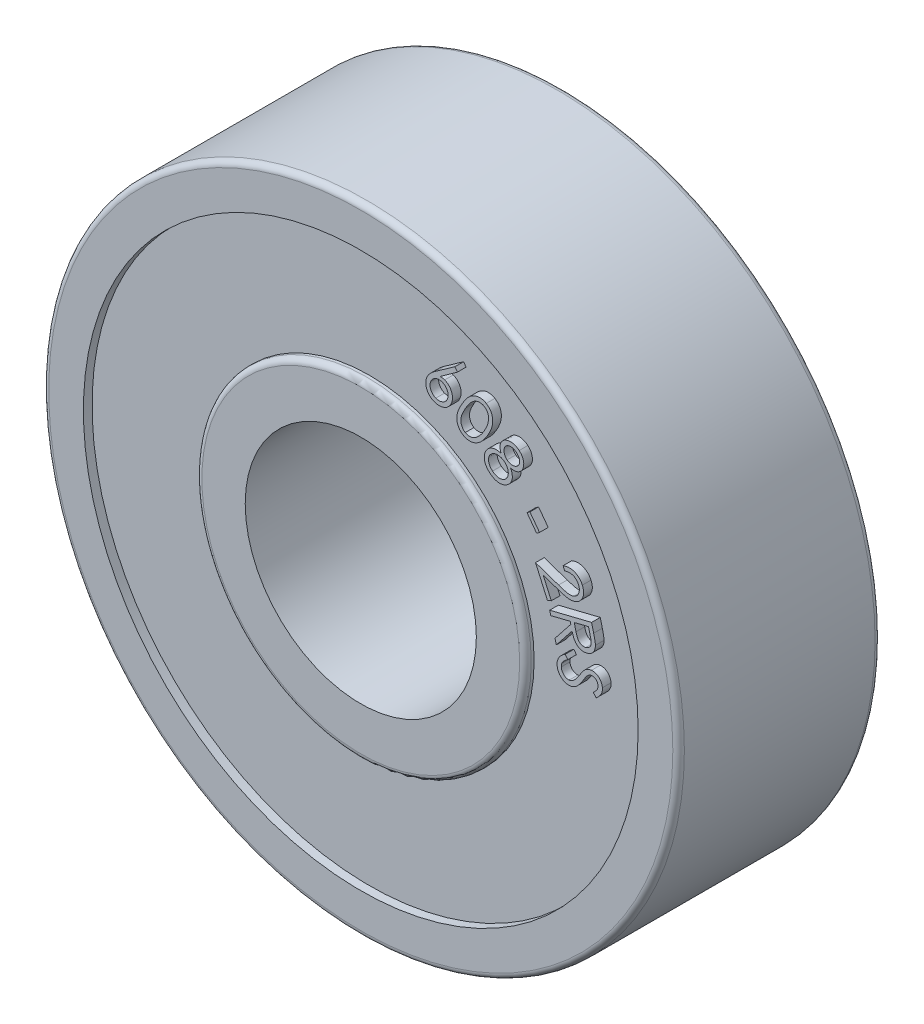
from build123d import *

# Parameters (mm, degrees)
SKETCH1_R           = 11
SKETCH1_R_2         = 4
BOSS_EXTRUDE1_DEPTH = 3.5
SKETCH2_R           = 9.6
SKETCH2_R_2         = 5.7
CUT_EXTRUDE1_DEPTH  = 0.3
BOSS_EXTRUDE2_DEPTH = 0.3
BOSS_EXTRUDE3_DEPTH = 0.3
FILLET1_R           = 0.2


with BuildPart() as part:
    # Sketch1 → Boss-Extrude1 (new, symmetric)
    with BuildSketch(Plane.XY):
        Circle(SKETCH1_R)
        Circle(SKETCH1_R_2, mode=Mode.SUBTRACT)
    extrude(amount=BOSS_EXTRUDE1_DEPTH, both=True)

    # Sketch2 → Cut-Extrude1 (cut)
    with BuildSketch(Plane.XY.offset(3.5)):
        Circle(SKETCH2_R)
        Circle(SKETCH2_R_2, mode=Mode.SUBTRACT)
    cut_extrude1 = extrude(amount=-CUT_EXTRUDE1_DEPTH, mode=Mode.SUBTRACT)

    # Mirror1: Cut-Extrude1 across plane
    add(cut_extrude1.mirror(Plane.XY), mode=Mode.SUBTRACT)

    # Sketch3 → Boss-Extrude2 (add)
    # profile 1 of 7: a face of its own
    with BuildSketch(Plane.XY.offset(3.2)):
        with BuildLine():
            Line((7.076977021, 1.026831682), (7.16261404, 0.905737932))
            add(Edge.make_bspline(
                [(7.16261404, 0.905737932), (7.143953551, 0.893236863), (7.108205969, 0.869288779), (7.06056557, 0.829882985), (7.020757414, 0.789733593), (6.988448077, 0.749115551), (6.963811614, 0.707551881), (6.947375688, 0.665037829), (6.938276612, 0.621569567), (6.938996525, 0.592474821), (6.939356828, 0.577913412)],
                knots=[0, 0, 0, 0, 1.293605249, 2.478137558, 3.555540967, 4.546146378, 5.461755128, 6.327764464, 7.163075533, 8, 8, 8, 8], degree=3))
            add(Edge.make_bspline(
                [(6.939356828, 0.577913412), (6.940739081, 0.565537488), (6.943468719, 0.541097811), (6.953161388, 0.505519096), (6.966666925, 0.471388616), (6.984370047, 0.439131725), (7.005303137, 0.409523368), (7.029721084, 0.384102636), (7.05633468, 0.362287286), (7.085768413, 0.345340342), (7.116782497, 0.332744465), (7.148571924, 0.324284886), (7.181020382, 0.319723973), (7.202767462, 0.320574799), (7.213695771, 0.321002355)],
                knots=[0, 0, 0, 0, 1.071200614, 2.115381178, 3.164681001, 4.22635561, 5.277356312, 6.278081387, 7.253536206, 8.231581676, 9.191190646, 10.128673544, 11.059623935, 12, 12, 12, 12], degree=3))
            add(Edge.make_bspline(
                [(7.213695771, 0.321002355), (7.226110859, 0.322572733), (7.25125408, 0.325753088), (7.28775569, 0.338706334), (7.323689363, 0.357136933), (7.345451164, 0.373911197), (7.356724617, 0.382600912)],
                knots=[0, 0, 0, 0, 0.947386718, 1.91866177, 2.921786489, 4, 4, 4, 4], degree=3))
            add(Edge.make_bspline(
                [(7.356724617, 0.382600912), (7.364813583, 0.389628685), (7.381832937, 0.404415264), (7.406956027, 0.429363903), (7.432849794, 0.458199259), (7.459816051, 0.490572468), (7.487667914, 0.526803949), (7.516961695, 0.56634168), (7.546528646, 0.610100438), (7.566404822, 0.640584944), (7.57667654, 0.656338893)],
                knots=[0, 0, 0, 0, 0.729652175, 1.535203374, 2.4093488, 3.368354771, 4.403997434, 5.521422745, 6.719107374, 8, 8, 8, 8], degree=3))
            add(Edge.make_bspline(
                [(7.57667654, 0.656338893), (7.586845788, 0.671994712), (7.606366936, 0.70204802), (7.634971739, 0.744455536), (7.661656964, 0.782221464), (7.685719931, 0.815594219), (7.708162319, 0.844198234), (7.727922923, 0.868580558), (7.746078344, 0.888083558), (7.75790782, 0.89898764), (7.763275098, 0.903935047)],
                knots=[0, 0, 0, 0, 1.44178108, 2.767679677, 3.950188744, 5.013127915, 5.944629057, 6.757769485, 7.436374313, 8, 8, 8, 8], degree=3))
            add(Edge.make_bspline(
                [(7.763275098, 0.903935047), (7.771591794, 0.910868396), (7.787977993, 0.924529017), (7.813968845, 0.942686052), (7.840832275, 0.958172569), (7.868075058, 0.972086454), (7.896578693, 0.982321616), (7.925425761, 0.990880251), (7.955077005, 0.997027612), (7.975189748, 0.999062782), (7.985330386, 1.000088893)],
                knots=[0, 0, 0, 0, 1.054938174, 2.078520909, 3.084687878, 4.075635399, 5.054733393, 6.030858732, 7.007179276, 8, 8, 8, 8], degree=3))
            add(Edge.make_bspline(
                [(7.985330386, 1.000088893), (8.001267523, 1.00072951), (8.032744484, 1.001994772), (8.079211889, 0.996231088), (8.124081582, 0.98521497), (8.166615863, 0.967586564), (8.206692348, 0.944913266), (8.242976732, 0.916638591), (8.275596042, 0.883535215), (8.303538509, 0.845444786), (8.326841926, 0.803821237), (8.345191599, 0.759648622), (8.35735167, 0.712884477), (8.360923889, 0.680741446), (8.362734232, 0.664451874)],
                knots=[0, 0, 0, 0, 1.017889249, 2.010402424, 2.980745164, 3.962632264, 4.943203903, 5.915044624, 6.892791457, 7.904219134, 8.924520923, 9.934955524, 10.95346856, 12, 12, 12, 12], degree=3))
            add(Edge.make_bspline(
                [(8.362734232, 0.664451874), (8.363393546, 0.64711594), (8.364705164, 0.612628356), (8.358517316, 0.561201148), (8.345193942, 0.51117226), (8.329398855, 0.470421111), (8.312505222, 0.438240125), (8.296867942, 0.413551552), (8.278710356, 0.388172359), (8.257904945, 0.362238911), (8.234177612, 0.336008695), (8.207794176, 0.30906866), (8.178845143, 0.281584261), (8.158173733, 0.263536203), (8.147590001, 0.254295624)],
                knots=[0, 0, 0, 0, 1.291665064, 2.569599581, 3.842596004, 5.143012825, 5.817581684, 6.548808337, 7.319484446, 8.142651535, 9.025540372, 9.954721754, 10.952820519, 12, 12, 12, 12], degree=3))
            Line((8.147590001, 0.254295624), (8.046327982, 0.369079278))
            add(Edge.make_bspline(
                [(8.046327982, 0.369079278), (8.054808236, 0.376518886), (8.071224301, 0.390920471), (8.093851206, 0.412898017), (8.114490779, 0.433553619), (8.132398373, 0.453506915), (8.14861815, 0.47203786), (8.162014547, 0.490021174), (8.17328618, 0.506954805), (8.185339631, 0.528004863), (8.196219668, 0.554807158), (8.205567479, 0.58750672), (8.209437103, 0.621499028), (8.208674086, 0.644216578), (8.208287117, 0.655737932)],
                knots=[0, 0, 0, 0, 1.182968606, 2.289989326, 3.307674873, 4.244684074, 5.10153492, 5.889410666, 6.594499546, 7.234271039, 8.430228475, 9.617852257, 10.791878183, 12, 12, 12, 12], degree=3))
            add(Edge.make_bspline(
                [(8.208287117, 0.655737932), (8.206639582, 0.6701768), (8.203461531, 0.698028992), (8.189722729, 0.736909497), (8.170123736, 0.771483686), (8.143419504, 0.800105933), (8.112644102, 0.82298413), (8.078518102, 0.839151649), (8.04142404, 0.847585469), (8.016015895, 0.84689522), (8.003058751, 0.84654322)],
                knots=[0, 0, 0, 0, 1.110394153, 2.141920708, 3.135757366, 4.13523793, 5.117629558, 6.05836752, 7.009844671, 8, 8, 8, 8], degree=3))
            add(Edge.make_bspline(
                [(8.003058751, 0.84654322), (7.995026578, 0.845576852), (7.979032128, 0.843652524), (7.955235638, 0.838316428), (7.932332641, 0.829698112), (7.90949921, 0.81911702), (7.886740517, 0.804880862), (7.863749665, 0.786360951), (7.839938307, 0.763736571), (7.824738694, 0.746510417), (7.816760675, 0.737468701)],
                knots=[0, 0, 0, 0, 0.873906778, 1.740208662, 2.626887475, 3.51277343, 4.455717877, 5.51881187, 6.697666299, 8, 8, 8, 8], degree=3))
            add(Edge.make_bspline(
                [(7.816760675, 0.737468701), (7.814144598, 0.734072382), (7.807897629, 0.725962258), (7.797344404, 0.71152694), (7.784614273, 0.692492833), (7.768831067, 0.669428131), (7.750915572, 0.641640422), (7.730201359, 0.609641867), (7.70703736, 0.573135871), (7.690754526, 0.547367351), (7.68214529, 0.533742739)],
                knots=[0, 0, 0, 0, 0.421234646, 1.005872833, 1.756541361, 2.670954, 3.751907505, 5.004912659, 6.416404901, 8, 8, 8, 8], degree=3))
            add(Edge.make_bspline(
                [(7.68214529, 0.533742739), (7.671599929, 0.517270609), (7.651183712, 0.48537994), (7.620329367, 0.439763357), (7.589576935, 0.398563061), (7.560275242, 0.360608304), (7.531107076, 0.327070161), (7.502782677, 0.297150285), (7.475373632, 0.270825586), (7.439697443, 0.242162709), (7.395614314, 0.212228908), (7.340862925, 0.185535339), (7.285399061, 0.166838821), (7.247479071, 0.162226438), (7.228719809, 0.159944662)],
                knots=[0, 0, 0, 0, 1.15394133, 2.234074179, 3.248141619, 4.186759783, 5.062319707, 5.86904735, 6.617296673, 7.302091977, 8.56736697, 9.751360306, 10.887583529, 12, 12, 12, 12], degree=3))
            add(Edge.make_bspline(
                [(7.228719809, 0.159944662), (7.215399812, 0.159400368), (7.189032425, 0.15832292), (7.149817826, 0.160981639), (7.111673035, 0.168023285), (7.074513011, 0.178889988), (7.038366226, 0.193684711), (7.003230068, 0.212372732), (6.969623596, 0.235551471), (6.937081374, 0.261658139), (6.906889434, 0.290843894), (6.880151097, 0.322608377), (6.856386952, 0.355945173), (6.836912749, 0.391652709), (6.820871989, 0.429074386), (6.808537082, 0.468431471), (6.799656903, 0.5097804), (6.796852939, 0.538210436), (6.79542654, 0.552673028)],
                knots=[0, 0, 0, 0, 0.984918958, 1.94968061, 2.897938618, 3.84677448, 4.806409233, 5.780190585, 6.782267682, 7.819421653, 8.861321141, 9.880375071, 10.884774166, 11.882163574, 12.880541693, 13.889731705, 14.926489235, 16, 16, 16, 16], degree=3))
            add(Edge.make_bspline(
                [(6.79542654, 0.552673028), (6.794757698, 0.563886346), (6.793432368, 0.586105877), (6.79440608, 0.619264579), (6.797810279, 0.651765847), (6.803024584, 0.683783604), (6.811278969, 0.714959521), (6.821643433, 0.745520813), (6.833738608, 0.775651717), (6.849062745, 0.80497269), (6.866809983, 0.833979693), (6.887692934, 0.862537349), (6.911493638, 0.89093824), (6.938674141, 0.918654811), (6.968492131, 0.946649328), (7.001930338, 0.973621235), (7.038019591, 1.000967687), (7.063758258, 1.018055692), (7.076977021, 1.026831682)],
                knots=[0, 0, 0, 0, 0.925199492, 1.833310964, 2.729190912, 3.616477546, 4.503188332, 5.382649839, 6.274568056, 7.175148828, 8.105047403, 9.074003634, 10.08731401, 11.155334203, 12.270642315, 13.455154994, 14.693028539, 16, 16, 16, 16], degree=3))
        make_face()
    # profile 2 of 7: a face of its own
    with BuildSketch(Plane.XY.offset(3.2)):
        with BuildLine():
            Line((7.988249057, 2.436477879), (8.059763481, 2.14771586))
            add(Edge.make_bspline(
                [(8.059763481, 2.14771586), (8.064566506, 2.128407137), (8.073780818, 2.091364534), (8.085468727, 2.037955292), (8.096386616, 1.989498601), (8.104571978, 1.945536771), (8.111728491, 1.906438013), (8.11651398, 1.871946333), (8.119770695, 1.842285832), (8.120451336, 1.824004119), (8.120761077, 1.81568461)],
                knots=[0, 0, 0, 0, 1.412275468, 2.709364054, 3.880762931, 4.937697293, 5.883315439, 6.701766271, 7.409209202, 8, 8, 8, 8], degree=3))
            add(Edge.make_bspline(
                [(8.120761077, 1.81568461), (8.120776205, 1.804455954), (8.120805995, 1.782345383), (8.117122538, 1.749642538), (8.112002537, 1.717824468), (8.103880788, 1.687012638), (8.092733809, 1.657460157), (8.080091017, 1.62848464), (8.064205203, 1.600792231), (8.046264648, 1.57415575), (8.026330681, 1.548883112), (8.0038731, 1.525950847), (7.979450999, 1.505102958), (7.952912844, 1.486540832), (7.924590709, 1.469808257), (7.894006475, 1.455787629), (7.861485991, 1.443622059), (7.838767125, 1.437495917), (7.827191365, 1.434374514)],
                knots=[0, 0, 0, 0, 1.030695119, 2.029562332, 3.018848375, 3.989691521, 4.950321672, 5.918195338, 6.890563358, 7.878179212, 8.866823208, 9.842841206, 10.821890458, 11.812373873, 12.814456695, 13.839468472, 14.899161852, 16, 16, 16, 16], degree=3))
            add(Edge.make_bspline(
                [(7.827191365, 1.434374514), (7.807842429, 1.430242147), (7.770031648, 1.42216687), (7.713008492, 1.419161347), (7.657914739, 1.424442269), (7.60493808, 1.436817214), (7.554914707, 1.4574124), (7.50889861, 1.485783547), (7.466570201, 1.521074498), (7.435214739, 1.556388671), (7.412079066, 1.588533261), (7.395751148, 1.616043569), (7.379662863, 1.64611605), (7.364863908, 1.679274569), (7.35034608, 1.714990652), (7.336934555, 1.753663381), (7.323933649, 1.795004828), (7.316356122, 1.823763823), (7.312467807, 1.838521148)],
                knots=[0, 0, 0, 0, 1.275058133, 2.491658637, 3.66645437, 4.835727489, 5.988980319, 7.140493755, 8.310427396, 9.53238789, 10.176174421, 10.863292094, 11.594657208, 12.375481033, 13.204677601, 14.081459806, 15.015524659, 16, 16, 16, 16], degree=3))
            Line((7.312467807, 1.838521148), (6.767395692, 1.150119706))
            Line((6.767395692, 1.150119706), (6.722924538, 1.329506725))
            Line((6.722924538, 1.329506725), (7.268297134, 2.016706244))
            Line((7.268297134, 2.016706244), (7.247864442, 2.099638937))
            Line((7.247864442, 2.099638937), (6.573585596, 1.93287211))
            Line((6.573585596, 1.93287211), (6.537828384, 2.077703841))
            Line((6.537828384, 2.077703841), (7.988249057, 2.436477879))
        make_face()
        with BuildLine():
            Line((7.881878865, 2.256489898), (7.389090404, 2.134494706))
            Line((7.389090404, 2.134494706), (7.448886077, 1.884795187))
            add(Edge.make_bspline(
                [(7.448886077, 1.884795187), (7.45182527, 1.873158867), (7.457520768, 1.85061029), (7.466838888, 1.818246483), (7.476313313, 1.788288956), (7.486726516, 1.761214146), (7.496340237, 1.73629989), (7.507002503, 1.714323086), (7.517754957, 1.6947112), (7.532255082, 1.672175304), (7.552615295, 1.648055162), (7.579700381, 1.623195142), (7.610547944, 1.60386531), (7.643996391, 1.589418931), (7.679367087, 1.58013706), (7.715812573, 1.576210425), (7.752898708, 1.577633305), (7.777261552, 1.582662429), (7.789631269, 1.58521586)],
                knots=[0, 0, 0, 0, 1.113104627, 2.156947082, 3.123516869, 4.025994073, 4.847154809, 5.599249428, 6.289533952, 6.920849126, 8.081774125, 9.206640824, 10.317455789, 11.440940587, 12.574367923, 13.695699714, 14.830040429, 16, 16, 16, 16], degree=3))
            add(Edge.make_bspline(
                [(7.789631269, 1.58521586), (7.801466822, 1.588694436), (7.824748285, 1.595537069), (7.857407395, 1.61139247), (7.886733034, 1.632194925), (7.913064883, 1.656700921), (7.935729281, 1.684464794), (7.953040426, 1.715077862), (7.966255238, 1.747389364), (7.971981167, 1.776400765), (7.974560954, 1.801413296), (7.974215186, 1.822815659), (7.973109763, 1.846583651), (7.970321076, 1.872755814), (7.965921922, 1.901369873), (7.960758064, 1.932518189), (7.953232016, 1.965981516), (7.947804353, 1.989067449), (7.944979827, 2.001081244)],
                knots=[0, 0, 0, 0, 1.167139315, 2.295854676, 3.419774794, 4.560981809, 5.694511835, 6.79953169, 7.881294031, 8.986598963, 9.587027662, 10.260653181, 11.01114033, 11.840973709, 12.752038354, 13.753427265, 14.830895641, 16, 16, 16, 16], degree=3))
            Line((7.944979827, 2.001081244), (7.881878865, 2.256489898))
        make_face(mode=Mode.SUBTRACT)
    # profile 3 of 7: a face of its own
    with BuildSketch(Plane.XY.offset(3.2)):
        with BuildLine():
            Line((7.060414561, 3.511869289), (7.002121291, 3.642878905))
            add(Edge.make_bspline(
                [(7.002121291, 3.642878905), (7.019046748, 3.649389983), (7.052264502, 3.662168569), (7.102995457, 3.675884268), (7.15312825, 3.685189402), (7.202773241, 3.689013412), (7.251884723, 3.688168907), (7.300394616, 3.682404913), (7.348464968, 3.671920608), (7.395349292, 3.65618022), (7.44047839, 3.636600891), (7.482783144, 3.612959308), (7.522128502, 3.586041097), (7.557704328, 3.554681531), (7.590405951, 3.519949692), (7.619870525, 3.481439778), (7.645898532, 3.439065729), (7.660342449, 3.40884503), (7.667686195, 3.393479866)],
                knots=[0, 0, 0, 0, 1.098894236, 2.156680244, 3.181097666, 4.186217298, 5.170181954, 6.154689921, 7.14338444, 8.14775162, 9.148513895, 10.121757056, 11.081953369, 12.033139171, 12.991201477, 13.970187426, 14.967978787, 16, 16, 16, 16], degree=3))
            add(Edge.make_bspline(
                [(7.667686195, 3.393479866), (7.674187468, 3.377963146), (7.686913275, 3.347590201), (7.700739558, 3.30097043), (7.709843388, 3.254994719), (7.714160962, 3.20948296), (7.71357306, 3.16455023), (7.708131969, 3.120119203), (7.697846931, 3.076294825), (7.682780741, 3.033603885), (7.66396494, 2.992720057), (7.641997692, 2.954359041), (7.616965657, 2.919015209), (7.588887409, 2.886705424), (7.557908414, 2.857471081), (7.52379419, 2.831456311), (7.486939528, 2.808063438), (7.460303398, 2.79554429), (7.44683283, 2.789213039)],
                knots=[0, 0, 0, 0, 1.123118816, 2.198430154, 3.241560922, 4.249489758, 5.246456332, 6.237297923, 7.233725572, 8.247256701, 9.256117715, 10.236171318, 11.195918377, 12.144405917, 13.091003849, 14.035755774, 15.006631783, 16, 16, 16, 16], degree=3))
            add(Edge.make_bspline(
                [(7.44683283, 2.789213039), (7.427378747, 2.781362952), (7.388815176, 2.765801827), (7.328041872, 2.752027308), (7.266232349, 2.74509101), (7.21338116, 2.746502857), (7.168982396, 2.751905851), (7.131809362, 2.757993974), (7.090749349, 2.766016142), (7.046215934, 2.7771954), (6.997664279, 2.789510805), (6.945726546, 2.805202187), (6.889887114, 2.822482014), (6.851557914, 2.835216014), (6.831748695, 2.841797174)],
                knots=[0, 0, 0, 0, 1.190553923, 2.360019362, 3.527973818, 4.717996915, 5.354156506, 6.06911908, 6.858375339, 7.730926837, 8.678051452, 9.704712043, 10.813753963, 12, 12, 12, 12], degree=3))
            Line((6.831748695, 2.841797174), (6.313118888, 3.018479866))
            Line((6.313118888, 3.018479866), (6.594068407, 2.387470251))
            Line((6.594068407, 2.387470251), (6.462157349, 2.328876501))
            Line((6.462157349, 2.328876501), (6.048695811, 3.257362078))
            Line((6.048695811, 3.257362078), (6.845570811, 2.986328424))
            add(Edge.make_bspline(
                [(6.845570811, 2.986328424), (6.864880324, 2.979654683), (6.902002582, 2.966824514), (6.955788187, 2.949361597), (7.005326416, 2.934404588), (7.050483325, 2.921413436), (7.091296525, 2.91042929), (7.128008155, 2.902063834), (7.160335526, 2.89556277), (7.197451731, 2.89030818), (7.240572937, 2.888099792), (7.290432039, 2.892455892), (7.338939171, 2.902657183), (7.36935841, 2.91495087), (7.384633311, 2.921124097)],
                knots=[0, 0, 0, 0, 1.320807282, 2.539232813, 3.655652852, 4.666085234, 5.577070877, 6.38760905, 7.100050351, 7.708117777, 8.810154231, 9.882434552, 10.936672848, 12, 12, 12, 12], degree=3))
            add(Edge.make_bspline(
                [(7.384633311, 2.921124097), (7.393953216, 2.925535007), (7.412397621, 2.934264345), (7.437910988, 2.950628617), (7.461337911, 2.96917867), (7.482661533, 2.989848178), (7.501726104, 3.012807907), (7.518297817, 3.038123543), (7.533152326, 3.065449711), (7.545264251, 3.095012381), (7.554734935, 3.125595847), (7.561599178, 3.156528363), (7.564794112, 3.18756892), (7.565118837, 3.218655373), (7.56242574, 3.249874575), (7.556402541, 3.281091867), (7.546959071, 3.312338451), (7.53855548, 3.332648452), (7.534272734, 3.342999097)],
                knots=[0, 0, 0, 0, 0.993184646, 1.965545697, 2.914075148, 3.870045696, 4.823232639, 5.784649248, 6.782609973, 7.817265863, 8.858702921, 9.866240421, 10.866440821, 11.861032577, 12.859366931, 13.881967814, 14.920581025, 16, 16, 16, 16], degree=3))
            add(Edge.make_bspline(
                [(7.534272734, 3.342999097), (7.529263059, 3.353619747), (7.519435674, 3.374454077), (7.501556311, 3.403418667), (7.481572872, 3.429719323), (7.459659157, 3.453731432), (7.435089897, 3.474624827), (7.408866855, 3.493609022), (7.38021358, 3.509359536), (7.349799812, 3.522749246), (7.317713831, 3.532740249), (7.284388743, 3.540289181), (7.249798603, 3.5435502), (7.214004715, 3.544364892), (7.177100395, 3.541160915), (7.139045706, 3.534751997), (7.099850724, 3.525158857), (7.073776739, 3.516372201), (7.060414561, 3.511869289)],
                knots=[0, 0, 0, 0, 1.005912945, 1.973280471, 2.910778015, 3.834215764, 4.753293405, 5.670444424, 6.604358083, 7.550152227, 8.514008703, 9.480575917, 10.473212795, 11.486389798, 12.545830462, 13.642462933, 14.791829109, 16, 16, 16, 16], degree=3))
        make_face()
    # profile 4 of 7: a face of its own
    with BuildSketch(Plane.XY.offset(3.2)):
        Polygon((5.853954604, 4.681016256), (6.186286334, 4.231797506), (6.0868272, 4.158179718), (5.754495469, 4.607398468), align=None)
    # profile 5 of 7: a face of its own
    with BuildSketch(Plane.XY.offset(3.2)):
        with BuildLine():
            add(Edge.make_bspline(
                [(5.189386212, 5.6587177), (5.194586927, 5.646134291), (5.204749684, 5.621544959), (5.218070193, 5.584945038), (5.228712419, 5.549444832), (5.236378648, 5.515054238), (5.242378055, 5.482013139), (5.245308617, 5.450047942), (5.246005431, 5.419310243), (5.243603874, 5.380256122), (5.235024486, 5.33306466), (5.216198575, 5.279043079), (5.188843372, 5.227753223), (5.164922557, 5.196954938), (5.152727558, 5.181253758)],
                knots=[0, 0, 0, 0, 0.96444767, 1.884634333, 2.757917164, 3.587536687, 4.379562593, 5.13499021, 5.858836879, 6.555465729, 7.904015149, 9.241375117, 10.59363378, 12, 12, 12, 12], degree=3))
            add(Edge.make_bspline(
                [(5.152727558, 5.181253758), (5.143384508, 5.170771055), (5.124886846, 5.150017072), (5.094391988, 5.122081969), (5.06213001, 5.097158661), (5.027717717, 5.075988402), (4.991794542, 5.057345221), (4.953720021, 5.042352678), (4.91375897, 5.030611085), (4.886251485, 5.025285628), (4.872379, 5.022599912)],
                knots=[0, 0, 0, 0, 1.023323555, 2.026007946, 3.010521934, 3.991345134, 4.967944915, 5.957942348, 6.970156161, 8, 8, 8, 8], degree=3))
            add(Edge.make_bspline(
                [(4.872379, 5.022599912), (4.855081808, 5.02034445), (4.820776574, 5.015871231), (4.768971456, 5.01716734), (4.717633914, 5.024036589), (4.666684702, 5.037370524), (4.616291267, 5.057161873), (4.566396204, 5.08298636), (4.51692892, 5.114955513), (4.485546003, 5.14009974), (4.469434289, 5.153008565)],
                knots=[0, 0, 0, 0, 0.955510816, 1.895048748, 2.83201348, 3.791369806, 4.775830962, 5.795468925, 6.868213127, 8, 8, 8, 8], degree=3))
            add(Edge.make_bspline(
                [(4.469434289, 5.153008565), (4.454479521, 5.16618626), (4.425428449, 5.191785198), (4.38685707, 5.233165853), (4.35384453, 5.275311061), (4.32641646, 5.318497311), (4.305147872, 5.362863861), (4.288717111, 5.407948847), (4.278949315, 5.454285346), (4.274509417, 5.50096265), (4.275027634, 5.547130442), (4.278920555, 5.591819394), (4.28588695, 5.634753577), (4.297258447, 5.675629763), (4.311844388, 5.714750652), (4.330398062, 5.751916476), (4.352274696, 5.78737118), (4.369644338, 5.809124667), (4.378388615, 5.820075873)],
                knots=[0, 0, 0, 0, 1.268493105, 2.464169686, 3.595675489, 4.673202029, 5.714274908, 6.722806186, 7.720960851, 8.720398139, 9.702513272, 10.65633128, 11.574741911, 12.467418361, 13.353395327, 14.228959945, 15.108417628, 16, 16, 16, 16], degree=3))
            add(Edge.make_bspline(
                [(4.378388615, 5.820075873), (4.385081075, 5.827797463), (4.398317958, 5.843069842), (4.420057342, 5.863860192), (4.443106621, 5.88240479), (4.466730909, 5.899754668), (4.491730894, 5.91471382), (4.517767852, 5.927724759), (4.54489526, 5.938837935), (4.573261932, 5.948257679), (4.603090441, 5.955503895), (4.634456783, 5.960262193), (4.667508718, 5.962661604), (4.702137705, 5.962500408), (4.738563332, 5.960419006), (4.776582145, 5.955853476), (4.816274077, 5.948899516), (4.843056985, 5.942791111), (4.856754, 5.939667219)],
                knots=[0, 0, 0, 0, 0.937079849, 1.853431831, 2.754686371, 3.64983064, 4.540198755, 5.423712657, 6.317865965, 7.227373881, 8.163416963, 9.130297834, 10.134573654, 11.200477229, 12.305010558, 13.480102711, 14.711302252, 16, 16, 16, 16], degree=3))
            add(Edge.make_bspline(
                [(4.856754, 5.939667219), (4.849687556, 5.95814913), (4.836046158, 5.993827485), (4.82358244, 6.048280503), (4.818598542, 6.100938297), (4.820959731, 6.151721294), (4.830177268, 6.199924549), (4.84614947, 6.244922106), (4.867594369, 6.287113351), (4.886973834, 6.311846588), (4.896717942, 6.324282604)],
                knots=[0, 0, 0, 0, 1.163667917, 2.246399591, 3.276647655, 4.268313377, 5.229231514, 6.154147613, 7.07189459, 8, 8, 8, 8], degree=3))
            add(Edge.make_bspline(
                [(4.896717942, 6.324282604), (4.907683413, 6.336181438), (4.929626159, 6.359991916), (4.969424139, 6.389242169), (5.013794355, 6.413779497), (5.063010445, 6.432366377), (5.115105637, 6.445474527), (5.169137572, 6.450758711), (5.224123547, 6.449006456), (5.279443767, 6.439378345), (5.334103699, 6.423764691), (5.386624442, 6.401167554), (5.436588972, 6.372460307), (5.466812831, 6.348423436), (5.482054481, 6.336301835)],
                knots=[0, 0, 0, 0, 0.896649129, 1.794263584, 2.727688517, 3.704743748, 4.706942521, 5.701924564, 6.70909515, 7.752303184, 8.811867495, 9.858316991, 10.919966387, 12, 12, 12, 12], degree=3))
            add(Edge.make_bspline(
                [(5.482054481, 6.336301835), (5.496249425, 6.323543638), (5.524228154, 6.298396788), (5.55941752, 6.254658095), (5.589349943, 6.207855692), (5.612382396, 6.157469722), (5.629852896, 6.105468745), (5.639324054, 6.05243939), (5.642381776, 5.999181913), (5.637178257, 5.946408746), (5.6265171, 5.895173466), (5.608669998, 5.847198845), (5.585526413, 5.802428989), (5.56501446, 5.776122127), (5.554770827, 5.762984527)],
                knots=[0, 0, 0, 0, 1.070324559, 2.109646873, 3.141191903, 4.183098806, 5.213047539, 6.213764385, 7.199460029, 8.199164548, 9.183318134, 10.130076543, 11.066163551, 12, 12, 12, 12], degree=3))
            add(Edge.make_bspline(
                [(5.554770827, 5.762984527), (5.54379117, 5.750913532), (5.522131412, 5.727100871), (5.484194065, 5.697919216), (5.443016021, 5.674940222), (5.398496987, 5.658618015), (5.350659691, 5.649184159), (5.299689207, 5.645548973), (5.245326512, 5.648772373), (5.208462643, 5.655326203), (5.189386212, 5.6587177)],
                knots=[0, 0, 0, 0, 0.97532477, 1.924039999, 2.850048428, 3.789069322, 4.74981637, 5.759732031, 6.840699013, 8, 8, 8, 8], degree=3))
        make_face()
        with BuildLine():
            add(Edge.make_bspline(
                [(5.38409775, 6.230833085), (5.376379768, 6.237066801), (5.361182052, 6.249341806), (5.33710676, 6.265345425), (5.312356486, 6.278470878), (5.287483659, 6.289588881), (5.261856356, 6.297212228), (5.236003056, 6.303159158), (5.209497651, 6.306105023), (5.1829331, 6.306359877), (5.156899074, 6.304244254), (5.131945573, 6.300100204), (5.108243046, 6.293800963), (5.085926193, 6.285107914), (5.064985942, 6.273841909), (5.045476685, 6.260289737), (5.027245884, 6.244559564), (5.016392875, 6.232652172), (5.010900635, 6.226626354)],
                knots=[0, 0, 0, 0, 1.146485111, 2.25757925, 3.335045229, 4.382545061, 5.400645308, 6.420390147, 7.445837605, 8.476370927, 9.486937909, 10.461511295, 11.396776717, 12.317014496, 13.223529209, 14.13887382, 15.058164215, 16, 16, 16, 16], degree=3))
            add(Edge.make_bspline(
                [(5.010900635, 6.226626354), (5.005839109, 6.220224564), (4.99578683, 6.207510497), (4.983426128, 6.186494599), (4.973480349, 6.164339704), (4.966242115, 6.140687871), (4.961202053, 6.115942493), (4.958361054, 6.089776104), (4.958689929, 6.062428016), (4.960509576, 6.034150041), (4.965471075, 6.005950435), (4.972180325, 5.97851801), (4.981620808, 5.952617748), (4.993066388, 5.928009891), (5.006998383, 5.90477971), (5.023224391, 5.882778296), (5.041979743, 5.862262831), (5.055863823, 5.8498098), (5.062883808, 5.843513373)],
                knots=[0, 0, 0, 0, 0.918151234, 1.823464464, 2.737379604, 3.647108851, 4.60273986, 5.57807124, 6.604502568, 7.678956734, 8.765597248, 9.824305897, 10.855436574, 11.864617828, 12.876317318, 13.900515113, 14.938471084, 16, 16, 16, 16], degree=3))
            add(Edge.make_bspline(
                [(5.062883808, 5.843513373), (5.072382931, 5.835879565), (5.091268033, 5.820702875), (5.123398517, 5.803691573), (5.156881454, 5.789329176), (5.192577408, 5.780318195), (5.228880735, 5.775453144), (5.265198578, 5.775295787), (5.300730245, 5.780612822), (5.335287657, 5.790132952), (5.367520416, 5.803920679), (5.397136709, 5.820358669), (5.422986409, 5.840337391), (5.437576847, 5.855931193), (5.444794865, 5.863645585)],
                knots=[0, 0, 0, 0, 1.03473016, 2.057135568, 3.081244867, 4.129368344, 5.178115435, 6.192388268, 7.208521628, 8.225941052, 9.234323582, 10.184738541, 11.101974057, 12, 12, 12, 12], degree=3))
            add(Edge.make_bspline(
                [(5.444794865, 5.863645585), (5.449452204, 5.869450313), (5.458727382, 5.881010537), (5.469933396, 5.900173274), (5.479869867, 5.919987059), (5.48692058, 5.941301889), (5.492320197, 5.963609566), (5.496088768, 5.987015195), (5.496990346, 6.011574277), (5.496657021, 6.036918064), (5.493345511, 6.062740128), (5.487035173, 6.088363184), (5.477536944, 6.11350743), (5.465231668, 6.138289138), (5.449425244, 6.162344555), (5.43056933, 6.185829689), (5.408981013, 6.209173644), (5.392554652, 6.223471841), (5.38409775, 6.230833085)],
                knots=[0, 0, 0, 0, 0.858330494, 1.709381231, 2.557833814, 3.413822764, 4.294771091, 5.207644886, 6.145747529, 7.129250216, 8.132152716, 9.144946077, 10.169821944, 11.230308818, 12.334012682, 13.486582712, 14.705999292, 16, 16, 16, 16], degree=3))
        make_face(mode=Mode.SUBTRACT)
        with BuildLine():
            add(Edge.make_bspline(
                [(4.97784775, 5.739547027), (4.968072788, 5.747448585), (4.948936795, 5.762917101), (4.918274536, 5.782554535), (4.886833683, 5.798776336), (4.85473779, 5.812354609), (4.821419708, 5.821390433), (4.787585194, 5.827885912), (4.752845051, 5.830950849), (4.717744872, 5.830139612), (4.683127079, 5.826735311), (4.649883795, 5.819964745), (4.61826248, 5.810884891), (4.588648529, 5.798350704), (4.560743994, 5.783335654), (4.534786049, 5.76513744), (4.510593696, 5.744079755), (4.496218334, 5.728085402), (4.488965539, 5.720015777)],
                knots=[0, 0, 0, 0, 1.109464336, 2.171947235, 3.2085584, 4.231988469, 5.242955981, 6.250977867, 7.272111531, 8.316094379, 9.347711258, 10.340046327, 11.308516214, 12.248239019, 13.174500274, 14.102112258, 15.042459394, 16, 16, 16, 16], degree=3))
            add(Edge.make_bspline(
                [(4.488965539, 5.720015777), (4.480602073, 5.709435387), (4.463914822, 5.688324806), (4.44516328, 5.652410092), (4.431161138, 5.614012787), (4.422214489, 5.573509222), (4.41881507, 5.531633302), (4.421658006, 5.489673484), (4.430051638, 5.447930207), (4.445016207, 5.407080512), (4.465582648, 5.367187791), (4.491966576, 5.328877959), (4.524060519, 5.292291), (4.548718967, 5.270148342), (4.561381404, 5.258777796)],
                knots=[0, 0, 0, 0, 0.928098739, 1.851794183, 2.778041455, 3.739749631, 4.702597536, 5.664454449, 6.630047031, 7.628273754, 8.65362301, 9.716647006, 10.827468267, 12, 12, 12, 12], degree=3))
            add(Edge.make_bspline(
                [(4.561381404, 5.258777796), (4.571664343, 5.2504855), (4.591748181, 5.23428963), (4.623466144, 5.213534245), (4.655395661, 5.196250326), (4.687687255, 5.182607397), (4.72030531, 5.172636208), (4.753324826, 5.166107742), (4.786709776, 5.163930204), (4.820127427, 5.164733793), (4.852785724, 5.169038041), (4.884273979, 5.175735909), (4.913899909, 5.185990793), (4.94222114, 5.198101638), (4.968821603, 5.213231451), (4.993597613, 5.231167382), (5.016946341, 5.251616746), (5.030884662, 5.2671412), (5.037943904, 5.275003758)],
                knots=[0, 0, 0, 0, 1.188993062, 2.322248911, 3.407802256, 4.454786609, 5.47337354, 6.47460047, 7.478383676, 8.479935574, 9.480105628, 10.44081974, 11.373519153, 12.298510898, 13.21141825, 14.122586178, 15.049159707, 16, 16, 16, 16], degree=3))
            add(Edge.make_bspline(
                [(5.037943904, 5.275003758), (5.044375471, 5.282961476), (5.057111248, 5.298719333), (5.072220048, 5.324949766), (5.085118906, 5.352079119), (5.094665961, 5.380751623), (5.101340116, 5.410752664), (5.104894013, 5.442172707), (5.105425356, 5.474963787), (5.103029282, 5.508648241), (5.097668263, 5.542222213), (5.089567603, 5.574943402), (5.07853539, 5.606212629), (5.064173023, 5.635931829), (5.0470663, 5.664284415), (5.026752056, 5.690994432), (5.003917568, 5.716545673), (4.986625361, 5.731802557), (4.97784775, 5.739547027)],
                knots=[0, 0, 0, 0, 0.945492101, 1.872261549, 2.792845489, 3.722022135, 4.662046284, 5.63242696, 6.64292728, 7.692955472, 8.753567252, 9.785437493, 10.808611807, 11.816046644, 12.835013809, 13.867591537, 14.917578817, 16, 16, 16, 16], degree=3))
        make_face(mode=Mode.SUBTRACT)
    # profile 6 of 7: a face of its own
    with BuildSketch(Plane.XY.offset(3.2)):
        with BuildLine():
            add(Edge.make_bspline(
                [(3.510655427, 6.757478069), (3.523044396, 6.777992727), (3.547066884, 6.81777111), (3.584172519, 6.874306453), (3.620442947, 6.926465684), (3.656489787, 6.974017044), (3.692126867, 7.01698291), (3.727361389, 7.055365327), (3.762077889, 7.089102521), (3.796741048, 7.118263828), (3.831222307, 7.143674947), (3.865751559, 7.165957527), (3.90045395, 7.185168264), (3.934981652, 7.202005651), (3.97007852, 7.215147169), (4.005221314, 7.225645679), (4.040506165, 7.233748063), (4.075949707, 7.238015399), (4.111199703, 7.239941823), (4.145938078, 7.238900778), (4.180159284, 7.235854638), (4.213619587, 7.229198753), (4.246739278, 7.220830734), (4.278976138, 7.208669758), (4.310937007, 7.194889796), (4.33126479, 7.183351274), (4.341484754, 7.177550184)],
                knots=[0, 0, 0, 0, 1.647452083, 3.194446495, 4.648165615, 6.014348364, 7.295380384, 8.484425794, 9.594739905, 10.620989546, 11.596064572, 12.537719104, 13.443964193, 14.321744571, 15.176037305, 16.016960352, 16.842260648, 17.661332608, 18.468038747, 19.267067421, 20.04884938, 20.826740038, 21.610067052, 22.394271269, 23.192706311, 24, 24, 24, 24], degree=3))
            add(Edge.make_bspline(
                [(4.341484754, 7.177550184), (4.35157638, 7.171156227), (4.371584661, 7.158479173), (4.400033348, 7.137569921), (4.425760206, 7.114119938), (4.450107403, 7.089544584), (4.471988621, 7.062686788), (4.491794391, 7.034108182), (4.509723707, 7.003854765), (4.525259913, 6.971780276), (4.538489923, 6.938019117), (4.549382861, 6.902797577), (4.557465292, 6.866009703), (4.562856515, 6.827737256), (4.565507553, 6.787972877), (4.565505103, 6.746813505), (4.562578299, 6.704199779), (4.557690709, 6.659992141), (4.549117067, 6.614016125), (4.536958299, 6.566188899), (4.521400098, 6.516260364), (4.501512669, 6.464617202), (4.478843451, 6.41071913), (4.451873025, 6.355067688), (4.421172748, 6.297465922), (4.398886775, 6.258718379), (4.387458312, 6.238848261)],
                knots=[0, 0, 0, 0, 0.815693431, 1.617244076, 2.406711903, 3.190202769, 3.977445694, 4.768570701, 5.562646356, 6.376272847, 7.199244939, 8.036444902, 8.891007748, 9.768257746, 10.673118776, 11.610079517, 12.576359211, 13.588411736, 14.645450033, 15.766754462, 16.95644851, 18.213974558, 19.543952273, 20.947990746, 22.434899919, 24, 24, 24, 24], degree=3))
            add(Edge.make_bspline(
                [(4.387458312, 6.238848261), (4.375658761, 6.219343172), (4.352628649, 6.181273556), (4.317015222, 6.12693388), (4.281094073, 6.076914483), (4.245482688, 6.03085953), (4.209716836, 5.989101968), (4.174163403, 5.951247704), (4.138599853, 5.917538667), (4.102583564, 5.888222522), (4.066523088, 5.862700694), (4.030905805, 5.839518437), (3.994689615, 5.820274298), (3.958931747, 5.802996011), (3.92260917, 5.789652272), (3.88645934, 5.778626546), (3.850015276, 5.771215034), (3.813779971, 5.766277694), (3.777697606, 5.764570654), (3.742237354, 5.765401052), (3.707378153, 5.769063793), (3.673201098, 5.775314714), (3.639645532, 5.784402646), (3.60681343, 5.796197118), (3.574503026, 5.810561928), (3.553836929, 5.822211912), (3.543407831, 5.82809105)],
                knots=[0, 0, 0, 0, 1.558036171, 3.040941719, 4.439181865, 5.766105195, 7.018758616, 8.195542268, 9.314262581, 10.365268165, 11.366397101, 12.333015677, 13.267287763, 14.167636221, 15.044996405, 15.909224775, 16.748361006, 17.583915235, 18.406439406, 19.214506741, 20.006050072, 20.7996039, 21.586753692, 22.379273342, 23.18210401, 24, 24, 24, 24], degree=3))
            add(Edge.make_bspline(
                [(3.543407831, 5.82809105), (3.533371112, 5.834222027), (3.513446744, 5.846392921), (3.4859508, 5.867634543), (3.460215189, 5.890275817), (3.436376068, 5.91449691), (3.415042137, 5.940946833), (3.395438201, 5.968727292), (3.378234839, 5.998576142), (3.362926718, 6.029946443), (3.350010977, 6.062988716), (3.339702901, 6.097450294), (3.332346395, 6.133267892), (3.327118607, 6.170393396), (3.324804356, 6.208965371), (3.325107403, 6.248921828), (3.328290826, 6.290138168), (3.333588674, 6.332935955), (3.342437557, 6.377731339), (3.355078035, 6.424811406), (3.371933678, 6.474224228), (3.391969843, 6.526246344), (3.416300618, 6.580616153), (3.44378607, 6.637675383), (3.475540167, 6.697017252), (3.498712776, 6.736915429), (3.510655427, 6.757478069)],
                knots=[0, 0, 0, 0, 0.809193552, 1.606368565, 2.388062977, 3.168296049, 3.942656184, 4.725080242, 5.506865897, 6.311817253, 7.126253287, 7.946594166, 8.785109086, 9.641356877, 10.525743148, 11.442912133, 12.390151821, 13.370352211, 14.410340417, 15.531053157, 16.723869266, 18.003186525, 19.367808404, 20.823527324, 22.362916106, 24, 24, 24, 24], degree=3))
        make_face()
        with BuildLine():
            add(Edge.make_bspline(
                [(3.630547254, 6.682958838), (3.620221449, 6.665392902), (3.600197137, 6.631328171), (3.572929949, 6.580873879), (3.548762085, 6.532984005), (3.527752928, 6.487670761), (3.509592396, 6.445062341), (3.494690308, 6.404998563), (3.48327332, 6.367437537), (3.474683849, 6.332232668), (3.468824287, 6.298800657), (3.46571246, 6.266653396), (3.463918864, 6.235458038), (3.46493127, 6.205223656), (3.467851261, 6.17598656), (3.473053152, 6.147772275), (3.480147422, 6.120497225), (3.492538125, 6.086133107), (3.511542662, 6.046330999), (3.541241334, 6.004751405), (3.575554847, 5.968808063), (3.602817938, 5.950907328), (3.616424658, 5.941973261)],
                knots=[0, 0, 0, 0, 1.47554823, 2.861456041, 4.152549281, 5.359823398, 6.478019408, 7.506149652, 8.453830721, 9.319422576, 10.129142106, 10.909376059, 11.657384493, 12.390328903, 13.097664623, 13.7834344, 14.466089735, 15.136024757, 16.427179125, 17.644803262, 18.824546301, 20, 20, 20, 20], degree=3))
            add(Edge.make_bspline(
                [(3.616424658, 5.941973261), (3.630918357, 5.934323454), (3.659826954, 5.919065431), (3.707720825, 5.905701424), (3.757986558, 5.900147741), (3.801413513, 5.901627178), (3.836656266, 5.907822604), (3.863650946, 5.914090585), (3.890256786, 5.923897556), (3.917102703, 5.935010136), (3.943602815, 5.949510015), (3.970169637, 5.965831061), (3.99667447, 5.984708597), (4.013647091, 5.998753811), (4.022374177, 6.005975665)],
                knots=[0, 0, 0, 0, 1.338007035, 2.668739434, 4.038183073, 5.465466408, 6.20521133, 6.964583444, 7.729288881, 8.522454135, 9.340140568, 10.197647248, 11.073255203, 12, 12, 12, 12], degree=3))
            add(Edge.make_bspline(
                [(4.022374177, 6.005975665), (4.03309713, 6.015376839), (4.054953289, 6.03453887), (4.086306835, 6.065965767), (4.117690502, 6.099557924), (4.148320767, 6.136006696), (4.178355036, 6.175206221), (4.208030466, 6.216891631), (4.237288919, 6.261196197), (4.255949618, 6.291969613), (4.265463119, 6.307658357)],
                knots=[0, 0, 0, 0, 0.879205792, 1.792049364, 2.736102679, 3.713611354, 4.72667386, 5.780746889, 6.868591834, 8, 8, 8, 8], degree=3))
            add(Edge.make_bspline(
                [(4.265463119, 6.307658357), (4.274701981, 6.323514803), (4.292784055, 6.354548652), (4.317165172, 6.40114321), (4.339658699, 6.445960019), (4.359325487, 6.48948444), (4.375664307, 6.531852093), (4.389941909, 6.572591521), (4.401881133, 6.611803542), (4.410380466, 6.649845295), (4.417219564, 6.686291851), (4.421429902, 6.721323751), (4.423246033, 6.754950805), (4.422978321, 6.787068772), (4.420697686, 6.817826855), (4.415913831, 6.847098643), (4.408669375, 6.874831814), (4.396336672, 6.909230621), (4.377074091, 6.948651577), (4.348216969, 6.990447515), (4.314216194, 7.026302644), (4.287086736, 7.044024882), (4.2735761, 7.052850665)],
                knots=[0, 0, 0, 0, 1.328710852, 2.600520349, 3.807127993, 4.959618234, 6.05731199, 7.094083991, 8.085413991, 9.023161106, 9.91513934, 10.769772044, 11.576009719, 12.352094753, 13.094153729, 13.807183223, 14.496772946, 15.166628375, 16.45111389, 17.660269213, 18.834799754, 20, 20, 20, 20], degree=3))
            add(Edge.make_bspline(
                [(4.2735761, 7.052850665), (4.259091849, 7.060534617), (4.230141022, 7.075893146), (4.181942627, 7.088762641), (4.131168922, 7.094220524), (4.087273895, 7.091925443), (4.051336593, 7.08670747), (4.024286388, 7.079553647), (3.997254181, 7.07048761), (3.97030279, 7.059101918), (3.943479975, 7.045236739), (3.917054607, 7.028802461), (3.890388513, 7.010491246), (3.863871328, 6.989215122), (3.83673365, 6.96498905), (3.809536022, 6.936587441), (3.781616888, 6.904273484), (3.752620278, 6.868084373), (3.723073149, 6.827597501), (3.692803039, 6.782981022), (3.661390378, 6.734643902), (3.641049542, 6.700557945), (3.630547254, 6.682958838)],
                knots=[0, 0, 0, 0, 1.18305455, 2.364665469, 3.581918313, 4.865940634, 5.533173231, 6.206361281, 6.886997529, 7.594978164, 8.321014114, 9.069243509, 9.845210403, 10.660099312, 11.527346371, 12.475480957, 13.502864451, 14.616541664, 15.829753734, 17.128255368, 18.517273796, 20, 20, 20, 20], degree=3))
        make_face(mode=Mode.SUBTRACT)
    # profile 7 of 7: a face of its own
    with BuildSketch(Plane.XY.offset(3.2)):
        with BuildLine():
            Line((3.259020931, 7.735829686), (3.345258912, 7.616839302))
            Line((3.345258912, 7.616839302), (2.750607469, 7.189555648))
            add(Edge.make_bspline(
                [(2.750607469, 7.189555648), (2.764549948, 7.188768772), (2.791636716, 7.187240067), (2.831031151, 7.181431645), (2.868006815, 7.172988132), (2.891298195, 7.164733108), (2.902650739, 7.160709494)],
                knots=[0, 0, 0, 0, 1.077632327, 2.093571702, 3.07078029, 4, 4, 4, 4], degree=3))
            add(Edge.make_bspline(
                [(2.902650739, 7.160709494), (2.916090094, 7.155155715), (2.942547261, 7.14422236), (2.979740198, 7.123606836), (3.013803711, 7.099758429), (3.045057297, 7.072903951), (3.073099721, 7.04254215), (3.098426575, 7.009227952), (3.120370067, 6.972559122), (3.139170476, 6.933431116), (3.154402733, 6.892603901), (3.165629764, 6.850862229), (3.172639004, 6.808794755), (3.174970551, 6.766292559), (3.1731812, 6.72351375), (3.166980992, 6.680292502), (3.157027941, 6.636604949), (3.146744742, 6.608132737), (3.14153295, 6.593702283)],
                knots=[0, 0, 0, 0, 1.01743847, 2.002963574, 2.969775988, 3.92430442, 4.881892947, 5.857993209, 6.848916855, 7.868214235, 8.893283992, 9.895138317, 10.889998981, 11.873301365, 12.869915045, 13.882412113, 14.926751651, 16, 16, 16, 16], degree=3))
            add(Edge.make_bspline(
                [(3.14153295, 6.593702283), (3.133298806, 6.574335332), (3.117104725, 6.536246378), (3.084853049, 6.483861036), (3.046740354, 6.437177334), (3.002987092, 6.396551772), (2.954531996, 6.362006323), (2.901390622, 6.334923003), (2.844493748, 6.314490982), (2.784294505, 6.302249653), (2.722630825, 6.296907064), (2.660946131, 6.300117528), (2.599828817, 6.31068591), (2.560658246, 6.324037353), (2.540871892, 6.330781609)],
                knots=[0, 0, 0, 0, 1.035414346, 2.036347976, 3.017971465, 3.995346073, 4.96856579, 5.939381811, 6.923988381, 7.937006642, 8.956729741, 9.964339931, 10.971720631, 12, 12, 12, 12], degree=3))
            add(Edge.make_bspline(
                [(2.540871892, 6.330781609), (2.522287916, 6.338587102), (2.485509036, 6.354034672), (2.435056302, 6.386012116), (2.389022735, 6.423405339), (2.348114208, 6.466610687), (2.313615302, 6.514980969), (2.285972887, 6.567293347), (2.265999597, 6.623366189), (2.25347095, 6.682273063), (2.248790901, 6.742584133), (2.251449944, 6.802742105), (2.261757997, 6.862050957), (2.274734783, 6.900033915), (2.281256508, 6.919122956)],
                knots=[0, 0, 0, 0, 1.011779335, 2.002376177, 2.990089552, 3.987407483, 4.98363171, 5.967873775, 6.952141598, 7.966361115, 8.986649343, 9.984640704, 10.987143757, 12, 12, 12, 12], degree=3))
            add(Edge.make_bspline(
                [(2.281256508, 6.919122956), (2.287196006, 6.933372691), (2.299315356, 6.962448804), (2.323005097, 7.004468213), (2.35156851, 7.045743389), (2.378765534, 7.079593784), (2.40315448, 7.106990071), (2.424358282, 7.127899417), (2.447491043, 7.14955572), (2.472765548, 7.171775577), (2.500150602, 7.194576688), (2.529553612, 7.218120977), (2.561487153, 7.241739954), (2.58361555, 7.257499193), (2.594958431, 7.265577283)],
                knots=[0, 0, 0, 0, 1.170658157, 2.388689085, 3.651449214, 4.976093974, 5.681115574, 6.433500391, 7.23470353, 8.085522527, 8.986623187, 9.938565816, 10.9433214, 12, 12, 12, 12], degree=3))
            Line((2.594958431, 7.265577283), (3.259020931, 7.735829686))
        make_face()
        with BuildLine():
            add(Edge.make_bspline(
                [(2.822722854, 7.051334494), (2.812664531, 7.054833155), (2.792892789, 7.061710508), (2.762483465, 7.068606462), (2.732204718, 7.072630955), (2.701979002, 7.073169245), (2.671899286, 7.070697555), (2.641842537, 7.065403415), (2.611936713, 7.056441356), (2.582423833, 7.044896947), (2.554237541, 7.030567209), (2.527754939, 7.014283762), (2.503542141, 6.995676167), (2.482048958, 6.974301089), (2.461814806, 6.95165556), (2.444859602, 6.926036282), (2.429612015, 6.898662354), (2.421494436, 6.879147873), (2.417374296, 6.869243148)],
                knots=[0, 0, 0, 0, 1.033665586, 2.031886465, 3.02254153, 3.99555741, 4.961789888, 5.950245301, 6.953808469, 7.988937912, 9.024387298, 10.020520243, 11.005138471, 11.982037111, 12.961258017, 13.948803449, 14.958899352, 16, 16, 16, 16], degree=3))
            add(Edge.make_bspline(
                [(2.417374296, 6.869243148), (2.413874694, 6.859184725), (2.406995493, 6.839412784), (2.400113007, 6.809004903), (2.396038381, 6.778720785), (2.395683638, 6.7485223), (2.397472358, 6.718358765), (2.403534979, 6.688459439), (2.411826718, 6.658391164), (2.423571351, 6.628966413), (2.43777961, 6.6006627), (2.454454025, 6.574347171), (2.473041731, 6.550179122), (2.493997511, 6.52844107), (2.516843717, 6.508774884), (2.542092862, 6.491575205), (2.569326584, 6.476475716), (2.58876049, 6.468512639), (2.5985642, 6.464495552)],
                knots=[0, 0, 0, 0, 1.035635808, 2.03575935, 3.028302658, 4.003173159, 4.970511056, 5.962623562, 6.965403228, 8.002505683, 9.039928692, 10.043134578, 11.029629541, 12.001621073, 12.97634539, 13.957723193, 14.969744393, 16, 16, 16, 16], degree=3))
            add(Edge.make_bspline(
                [(2.5985642, 6.464495552), (2.608614119, 6.460871166), (2.628340671, 6.453757017), (2.658809337, 6.446942044), (2.689081611, 6.442890391), (2.719305402, 6.442374366), (2.749300715, 6.444775889), (2.779179597, 6.450264967), (2.809109964, 6.458681998), (2.838543073, 6.470381622), (2.866839604, 6.48460719), (2.893174719, 6.501258467), (2.917330785, 6.519964404), (2.939369416, 6.540709953), (2.959018859, 6.56367882), (2.976235907, 6.588909673), (2.991330659, 6.616148383), (2.999294383, 6.635581608), (3.003311796, 6.645384975)],
                knots=[0, 0, 0, 0, 1.038736636, 2.038891379, 3.031465653, 4.006366568, 4.974470939, 5.955249925, 6.958060875, 7.995195687, 9.032651061, 10.035888245, 11.022413985, 12.00149633, 12.976251057, 13.957659478, 14.969712251, 16, 16, 16, 16], degree=3))
            add(Edge.make_bspline(
                [(3.003311796, 6.645384975), (3.006935823, 6.655535416), (3.014051353, 6.675465114), (3.020830439, 6.706041291), (3.024844836, 6.736403745), (3.025836149, 6.766724068), (3.023303051, 6.79691761), (3.017943665, 6.826958503), (3.009018473, 6.856770187), (2.997490443, 6.886295299), (2.983047901, 6.914508471), (2.966981078, 6.941236806), (2.948208279, 6.965324563), (2.927312203, 6.987113813), (2.904345762, 7.006715726), (2.879296711, 7.02430232), (2.851946923, 7.039334935), (2.832522022, 7.047310903), (2.822722854, 7.051334494)],
                knots=[0, 0, 0, 0, 1.045816322, 2.053388946, 3.034268365, 4.017123179, 4.992925423, 5.97168047, 6.975112883, 8.010107458, 9.045421935, 10.049702598, 11.03419254, 12.004208527, 12.976951746, 13.96187406, 14.971838357, 16, 16, 16, 16], degree=3))
        make_face(mode=Mode.SUBTRACT)
    extrude(amount=BOSS_EXTRUDE2_DEPTH)

    # Sketch4 → Boss-Extrude3 (add)
    # profile 1 of 7: a face of its own
    with BuildSketch(Plane(origin=(0, 0, -3.2), x_dir=(-1, 0, 0), z_dir=(0, 0, -1))):
        with BuildLine():
            Line((7.076977021, 1.026831682), (7.16261404, 0.905737932))
            add(Edge.make_bspline(
                [(7.16261404, 0.905737932), (7.143953551, 0.893236863), (7.108205969, 0.869288779), (7.06056557, 0.829882985), (7.020757414, 0.789733593), (6.988448077, 0.749115551), (6.963811614, 0.707551881), (6.947375688, 0.665037829), (6.938276612, 0.621569567), (6.938996525, 0.592474821), (6.939356828, 0.577913412)],
                knots=[0, 0, 0, 0, 1.293605249, 2.478137558, 3.555540967, 4.546146378, 5.461755128, 6.327764464, 7.163075533, 8, 8, 8, 8], degree=3))
            add(Edge.make_bspline(
                [(6.939356828, 0.577913412), (6.940739081, 0.565537488), (6.943468719, 0.541097811), (6.953161388, 0.505519096), (6.966666925, 0.471388616), (6.984370047, 0.439131725), (7.005303137, 0.409523368), (7.029721084, 0.384102636), (7.05633468, 0.362287286), (7.085768413, 0.345340342), (7.116782497, 0.332744465), (7.148571924, 0.324284886), (7.181020382, 0.319723973), (7.202767462, 0.320574799), (7.213695771, 0.321002355)],
                knots=[0, 0, 0, 0, 1.071200614, 2.115381178, 3.164681001, 4.22635561, 5.277356312, 6.278081387, 7.253536206, 8.231581676, 9.191190646, 10.128673544, 11.059623935, 12, 12, 12, 12], degree=3))
            add(Edge.make_bspline(
                [(7.213695771, 0.321002355), (7.226110859, 0.322572733), (7.25125408, 0.325753088), (7.28775569, 0.338706334), (7.323689363, 0.357136933), (7.345451164, 0.373911197), (7.356724617, 0.382600912)],
                knots=[0, 0, 0, 0, 0.947386718, 1.91866177, 2.921786489, 4, 4, 4, 4], degree=3))
            add(Edge.make_bspline(
                [(7.356724617, 0.382600912), (7.364813583, 0.389628685), (7.381832937, 0.404415264), (7.406956027, 0.429363903), (7.432849794, 0.458199259), (7.459816051, 0.490572468), (7.487667914, 0.526803949), (7.516961695, 0.56634168), (7.546528646, 0.610100438), (7.566404822, 0.640584944), (7.57667654, 0.656338893)],
                knots=[0, 0, 0, 0, 0.729652175, 1.535203374, 2.4093488, 3.368354771, 4.403997434, 5.521422745, 6.719107374, 8, 8, 8, 8], degree=3))
            add(Edge.make_bspline(
                [(7.57667654, 0.656338893), (7.586845788, 0.671994712), (7.606366936, 0.70204802), (7.634971739, 0.744455536), (7.661656964, 0.782221464), (7.685719931, 0.815594219), (7.708162319, 0.844198234), (7.727922923, 0.868580558), (7.746078344, 0.888083558), (7.75790782, 0.89898764), (7.763275098, 0.903935047)],
                knots=[0, 0, 0, 0, 1.44178108, 2.767679677, 3.950188744, 5.013127915, 5.944629057, 6.757769485, 7.436374313, 8, 8, 8, 8], degree=3))
            add(Edge.make_bspline(
                [(7.763275098, 0.903935047), (7.771591794, 0.910868396), (7.787977993, 0.924529017), (7.813968845, 0.942686052), (7.840832275, 0.958172569), (7.868075058, 0.972086454), (7.896578693, 0.982321616), (7.925425761, 0.990880251), (7.955077005, 0.997027612), (7.975189748, 0.999062782), (7.985330386, 1.000088893)],
                knots=[0, 0, 0, 0, 1.054938174, 2.078520909, 3.084687878, 4.075635399, 5.054733393, 6.030858732, 7.007179276, 8, 8, 8, 8], degree=3))
            add(Edge.make_bspline(
                [(7.985330386, 1.000088893), (8.001267523, 1.00072951), (8.032744484, 1.001994772), (8.079211889, 0.996231088), (8.124081582, 0.98521497), (8.166615863, 0.967586564), (8.206692348, 0.944913266), (8.242976732, 0.916638591), (8.275596042, 0.883535215), (8.303538509, 0.845444786), (8.326841926, 0.803821237), (8.345191599, 0.759648622), (8.35735167, 0.712884477), (8.360923889, 0.680741446), (8.362734232, 0.664451874)],
                knots=[0, 0, 0, 0, 1.017889249, 2.010402424, 2.980745164, 3.962632264, 4.943203903, 5.915044624, 6.892791457, 7.904219134, 8.924520923, 9.934955524, 10.95346856, 12, 12, 12, 12], degree=3))
            add(Edge.make_bspline(
                [(8.362734232, 0.664451874), (8.363393546, 0.64711594), (8.364705164, 0.612628356), (8.358517316, 0.561201148), (8.345193942, 0.51117226), (8.329398855, 0.470421111), (8.312505222, 0.438240125), (8.296867942, 0.413551552), (8.278710356, 0.388172359), (8.257904945, 0.362238911), (8.234177612, 0.336008695), (8.207794176, 0.30906866), (8.178845143, 0.281584261), (8.158173733, 0.263536203), (8.147590001, 0.254295624)],
                knots=[0, 0, 0, 0, 1.291665064, 2.569599581, 3.842596004, 5.143012825, 5.817581684, 6.548808337, 7.319484446, 8.142651535, 9.025540372, 9.954721754, 10.952820519, 12, 12, 12, 12], degree=3))
            Line((8.147590001, 0.254295624), (8.046327982, 0.369079278))
            add(Edge.make_bspline(
                [(8.046327982, 0.369079278), (8.054808236, 0.376518886), (8.071224301, 0.390920471), (8.093851206, 0.412898017), (8.114490779, 0.433553619), (8.132398373, 0.453506915), (8.14861815, 0.47203786), (8.162014547, 0.490021174), (8.17328618, 0.506954805), (8.185339631, 0.528004863), (8.196219668, 0.554807158), (8.205567479, 0.58750672), (8.209437103, 0.621499028), (8.208674086, 0.644216578), (8.208287117, 0.655737932)],
                knots=[0, 0, 0, 0, 1.182968606, 2.289989326, 3.307674873, 4.244684074, 5.10153492, 5.889410666, 6.594499546, 7.234271039, 8.430228475, 9.617852257, 10.791878183, 12, 12, 12, 12], degree=3))
            add(Edge.make_bspline(
                [(8.208287117, 0.655737932), (8.206639582, 0.6701768), (8.203461531, 0.698028992), (8.189722729, 0.736909497), (8.170123736, 0.771483686), (8.143419504, 0.800105933), (8.112644102, 0.82298413), (8.078518102, 0.839151649), (8.04142404, 0.847585469), (8.016015895, 0.84689522), (8.003058751, 0.84654322)],
                knots=[0, 0, 0, 0, 1.110394153, 2.141920708, 3.135757366, 4.13523793, 5.117629558, 6.05836752, 7.009844671, 8, 8, 8, 8], degree=3))
            add(Edge.make_bspline(
                [(8.003058751, 0.84654322), (7.995026578, 0.845576852), (7.979032128, 0.843652524), (7.955235638, 0.838316428), (7.932332641, 0.829698112), (7.90949921, 0.81911702), (7.886740517, 0.804880862), (7.863749665, 0.786360951), (7.839938307, 0.763736571), (7.824738694, 0.746510417), (7.816760675, 0.737468701)],
                knots=[0, 0, 0, 0, 0.873906778, 1.740208662, 2.626887475, 3.51277343, 4.455717877, 5.51881187, 6.697666299, 8, 8, 8, 8], degree=3))
            add(Edge.make_bspline(
                [(7.816760675, 0.737468701), (7.814144598, 0.734072382), (7.807897629, 0.725962258), (7.797344404, 0.71152694), (7.784614273, 0.692492833), (7.768831067, 0.669428131), (7.750915572, 0.641640422), (7.730201359, 0.609641867), (7.70703736, 0.573135871), (7.690754526, 0.547367351), (7.68214529, 0.533742739)],
                knots=[0, 0, 0, 0, 0.421234646, 1.005872833, 1.756541361, 2.670954, 3.751907505, 5.004912659, 6.416404901, 8, 8, 8, 8], degree=3))
            add(Edge.make_bspline(
                [(7.68214529, 0.533742739), (7.671599929, 0.517270609), (7.651183712, 0.48537994), (7.620329367, 0.439763357), (7.589576935, 0.398563061), (7.560275242, 0.360608304), (7.531107076, 0.327070161), (7.502782677, 0.297150285), (7.475373632, 0.270825586), (7.439697443, 0.242162709), (7.395614314, 0.212228908), (7.340862925, 0.185535339), (7.285399061, 0.166838821), (7.247479071, 0.162226438), (7.228719809, 0.159944662)],
                knots=[0, 0, 0, 0, 1.15394133, 2.234074179, 3.248141619, 4.186759783, 5.062319707, 5.86904735, 6.617296673, 7.302091977, 8.56736697, 9.751360306, 10.887583529, 12, 12, 12, 12], degree=3))
            add(Edge.make_bspline(
                [(7.228719809, 0.159944662), (7.215399812, 0.159400368), (7.189032425, 0.15832292), (7.149817826, 0.160981639), (7.111673035, 0.168023285), (7.074513011, 0.178889988), (7.038366226, 0.193684711), (7.003230068, 0.212372732), (6.969623596, 0.235551471), (6.937081374, 0.261658139), (6.906889434, 0.290843894), (6.880151097, 0.322608377), (6.856386952, 0.355945173), (6.836912749, 0.391652709), (6.820871989, 0.429074386), (6.808537082, 0.468431471), (6.799656903, 0.5097804), (6.796852939, 0.538210436), (6.79542654, 0.552673028)],
                knots=[0, 0, 0, 0, 0.984918958, 1.94968061, 2.897938618, 3.84677448, 4.806409233, 5.780190585, 6.782267682, 7.819421653, 8.861321141, 9.880375071, 10.884774166, 11.882163574, 12.880541693, 13.889731705, 14.926489235, 16, 16, 16, 16], degree=3))
            add(Edge.make_bspline(
                [(6.79542654, 0.552673028), (6.794757698, 0.563886346), (6.793432368, 0.586105877), (6.79440608, 0.619264579), (6.797810279, 0.651765847), (6.803024584, 0.683783604), (6.811278969, 0.714959521), (6.821643433, 0.745520813), (6.833738608, 0.775651717), (6.849062745, 0.80497269), (6.866809983, 0.833979693), (6.887692934, 0.862537349), (6.911493638, 0.89093824), (6.938674141, 0.918654811), (6.968492131, 0.946649328), (7.001930338, 0.973621235), (7.038019591, 1.000967687), (7.063758258, 1.018055692), (7.076977021, 1.026831682)],
                knots=[0, 0, 0, 0, 0.925199492, 1.833310964, 2.729190912, 3.616477546, 4.503188332, 5.382649839, 6.274568056, 7.175148828, 8.105047403, 9.074003634, 10.08731401, 11.155334203, 12.270642315, 13.455154994, 14.693028539, 16, 16, 16, 16], degree=3))
        make_face()
    # profile 2 of 7: a face of its own
    with BuildSketch(Plane(origin=(0, 0, -3.2), x_dir=(-1, 0, 0), z_dir=(0, 0, -1))):
        with BuildLine():
            Line((7.988249057, 2.436477879), (8.059763481, 2.14771586))
            add(Edge.make_bspline(
                [(8.059763481, 2.14771586), (8.064566506, 2.128407137), (8.073780818, 2.091364534), (8.085468727, 2.037955292), (8.096386616, 1.989498601), (8.104571978, 1.945536771), (8.111728491, 1.906438013), (8.11651398, 1.871946333), (8.119770695, 1.842285832), (8.120451336, 1.824004119), (8.120761077, 1.81568461)],
                knots=[0, 0, 0, 0, 1.412275468, 2.709364054, 3.880762931, 4.937697293, 5.883315439, 6.701766271, 7.409209202, 8, 8, 8, 8], degree=3))
            add(Edge.make_bspline(
                [(8.120761077, 1.81568461), (8.120776205, 1.804455954), (8.120805995, 1.782345383), (8.117122538, 1.749642538), (8.112002537, 1.717824468), (8.103880788, 1.687012638), (8.092733809, 1.657460157), (8.080091017, 1.62848464), (8.064205203, 1.600792231), (8.046264648, 1.57415575), (8.026330681, 1.548883112), (8.0038731, 1.525950847), (7.979450999, 1.505102958), (7.952912844, 1.486540832), (7.924590709, 1.469808257), (7.894006475, 1.455787629), (7.861485991, 1.443622059), (7.838767125, 1.437495917), (7.827191365, 1.434374514)],
                knots=[0, 0, 0, 0, 1.030695119, 2.029562332, 3.018848375, 3.989691521, 4.950321672, 5.918195338, 6.890563358, 7.878179212, 8.866823208, 9.842841206, 10.821890458, 11.812373873, 12.814456695, 13.839468472, 14.899161852, 16, 16, 16, 16], degree=3))
            add(Edge.make_bspline(
                [(7.827191365, 1.434374514), (7.807842429, 1.430242147), (7.770031648, 1.42216687), (7.713008492, 1.419161347), (7.657914739, 1.424442269), (7.60493808, 1.436817214), (7.554914707, 1.4574124), (7.50889861, 1.485783547), (7.466570201, 1.521074498), (7.435214739, 1.556388671), (7.412079066, 1.588533261), (7.395751148, 1.616043569), (7.379662863, 1.64611605), (7.364863908, 1.679274569), (7.35034608, 1.714990652), (7.336934555, 1.753663381), (7.323933649, 1.795004828), (7.316356122, 1.823763823), (7.312467807, 1.838521148)],
                knots=[0, 0, 0, 0, 1.275058133, 2.491658637, 3.66645437, 4.835727489, 5.988980319, 7.140493755, 8.310427396, 9.53238789, 10.176174421, 10.863292094, 11.594657208, 12.375481033, 13.204677601, 14.081459806, 15.015524659, 16, 16, 16, 16], degree=3))
            Line((7.312467807, 1.838521148), (6.767395692, 1.150119706))
            Line((6.767395692, 1.150119706), (6.722924538, 1.329506725))
            Line((6.722924538, 1.329506725), (7.268297134, 2.016706244))
            Line((7.268297134, 2.016706244), (7.247864442, 2.099638937))
            Line((7.247864442, 2.099638937), (6.573585596, 1.93287211))
            Line((6.573585596, 1.93287211), (6.537828384, 2.077703841))
            Line((6.537828384, 2.077703841), (7.988249057, 2.436477879))
        make_face()
        with BuildLine():
            Line((7.881878865, 2.256489898), (7.389090404, 2.134494706))
            Line((7.389090404, 2.134494706), (7.448886077, 1.884795187))
            add(Edge.make_bspline(
                [(7.448886077, 1.884795187), (7.45182527, 1.873158867), (7.457520768, 1.85061029), (7.466838888, 1.818246483), (7.476313313, 1.788288956), (7.486726516, 1.761214146), (7.496340237, 1.73629989), (7.507002503, 1.714323086), (7.517754957, 1.6947112), (7.532255082, 1.672175304), (7.552615295, 1.648055162), (7.579700381, 1.623195142), (7.610547944, 1.60386531), (7.643996391, 1.589418931), (7.679367087, 1.58013706), (7.715812573, 1.576210425), (7.752898708, 1.577633305), (7.777261552, 1.582662429), (7.789631269, 1.58521586)],
                knots=[0, 0, 0, 0, 1.113104627, 2.156947082, 3.123516869, 4.025994073, 4.847154809, 5.599249428, 6.289533952, 6.920849126, 8.081774125, 9.206640824, 10.317455789, 11.440940587, 12.574367923, 13.695699714, 14.830040429, 16, 16, 16, 16], degree=3))
            add(Edge.make_bspline(
                [(7.789631269, 1.58521586), (7.801466822, 1.588694436), (7.824748285, 1.595537069), (7.857407395, 1.61139247), (7.886733034, 1.632194925), (7.913064883, 1.656700921), (7.935729281, 1.684464794), (7.953040426, 1.715077862), (7.966255238, 1.747389364), (7.971981167, 1.776400765), (7.974560954, 1.801413296), (7.974215186, 1.822815659), (7.973109763, 1.846583651), (7.970321076, 1.872755814), (7.965921922, 1.901369873), (7.960758064, 1.932518189), (7.953232016, 1.965981516), (7.947804353, 1.989067449), (7.944979827, 2.001081244)],
                knots=[0, 0, 0, 0, 1.167139315, 2.295854676, 3.419774794, 4.560981809, 5.694511835, 6.79953169, 7.881294031, 8.986598963, 9.587027662, 10.260653181, 11.01114033, 11.840973709, 12.752038354, 13.753427265, 14.830895641, 16, 16, 16, 16], degree=3))
            Line((7.944979827, 2.001081244), (7.881878865, 2.256489898))
        make_face(mode=Mode.SUBTRACT)
    # profile 3 of 7: a face of its own
    with BuildSketch(Plane(origin=(0, 0, -3.2), x_dir=(-1, 0, 0), z_dir=(0, 0, -1))):
        with BuildLine():
            Line((7.060414561, 3.511869289), (7.002121291, 3.642878905))
            add(Edge.make_bspline(
                [(7.002121291, 3.642878905), (7.019046748, 3.649389983), (7.052264502, 3.662168569), (7.102995457, 3.675884268), (7.15312825, 3.685189402), (7.202773241, 3.689013412), (7.251884723, 3.688168907), (7.300394616, 3.682404913), (7.348464968, 3.671920608), (7.395349292, 3.65618022), (7.44047839, 3.636600891), (7.482783144, 3.612959308), (7.522128502, 3.586041097), (7.557704328, 3.554681531), (7.590405951, 3.519949692), (7.619870525, 3.481439778), (7.645898532, 3.439065729), (7.660342449, 3.40884503), (7.667686195, 3.393479866)],
                knots=[0, 0, 0, 0, 1.098894236, 2.156680244, 3.181097666, 4.186217298, 5.170181954, 6.154689921, 7.14338444, 8.14775162, 9.148513895, 10.121757056, 11.081953369, 12.033139171, 12.991201477, 13.970187426, 14.967978787, 16, 16, 16, 16], degree=3))
            add(Edge.make_bspline(
                [(7.667686195, 3.393479866), (7.674187468, 3.377963146), (7.686913275, 3.347590201), (7.700739558, 3.30097043), (7.709843388, 3.254994719), (7.714160962, 3.20948296), (7.71357306, 3.16455023), (7.708131969, 3.120119203), (7.697846931, 3.076294825), (7.682780741, 3.033603885), (7.66396494, 2.992720057), (7.641997692, 2.954359041), (7.616965657, 2.919015209), (7.588887409, 2.886705424), (7.557908414, 2.857471081), (7.52379419, 2.831456311), (7.486939528, 2.808063438), (7.460303398, 2.79554429), (7.44683283, 2.789213039)],
                knots=[0, 0, 0, 0, 1.123118816, 2.198430154, 3.241560922, 4.249489758, 5.246456332, 6.237297923, 7.233725572, 8.247256701, 9.256117715, 10.236171318, 11.195918377, 12.144405917, 13.091003849, 14.035755774, 15.006631783, 16, 16, 16, 16], degree=3))
            add(Edge.make_bspline(
                [(7.44683283, 2.789213039), (7.427378747, 2.781362952), (7.388815176, 2.765801827), (7.328041872, 2.752027308), (7.266232349, 2.74509101), (7.21338116, 2.746502857), (7.168982396, 2.751905851), (7.131809362, 2.757993974), (7.090749349, 2.766016142), (7.046215934, 2.7771954), (6.997664279, 2.789510805), (6.945726546, 2.805202187), (6.889887114, 2.822482014), (6.851557914, 2.835216014), (6.831748695, 2.841797174)],
                knots=[0, 0, 0, 0, 1.190553923, 2.360019362, 3.527973818, 4.717996915, 5.354156506, 6.06911908, 6.858375339, 7.730926837, 8.678051452, 9.704712043, 10.813753963, 12, 12, 12, 12], degree=3))
            Line((6.831748695, 2.841797174), (6.313118888, 3.018479866))
            Line((6.313118888, 3.018479866), (6.594068407, 2.387470251))
            Line((6.594068407, 2.387470251), (6.462157349, 2.328876501))
            Line((6.462157349, 2.328876501), (6.048695811, 3.257362078))
            Line((6.048695811, 3.257362078), (6.845570811, 2.986328424))
            add(Edge.make_bspline(
                [(6.845570811, 2.986328424), (6.864880324, 2.979654683), (6.902002582, 2.966824514), (6.955788187, 2.949361597), (7.005326416, 2.934404588), (7.050483325, 2.921413436), (7.091296525, 2.91042929), (7.128008155, 2.902063834), (7.160335526, 2.89556277), (7.197451731, 2.89030818), (7.240572937, 2.888099792), (7.290432039, 2.892455892), (7.338939171, 2.902657183), (7.36935841, 2.91495087), (7.384633311, 2.921124097)],
                knots=[0, 0, 0, 0, 1.320807282, 2.539232813, 3.655652852, 4.666085234, 5.577070877, 6.38760905, 7.100050351, 7.708117777, 8.810154231, 9.882434552, 10.936672848, 12, 12, 12, 12], degree=3))
            add(Edge.make_bspline(
                [(7.384633311, 2.921124097), (7.393953216, 2.925535007), (7.412397621, 2.934264345), (7.437910988, 2.950628617), (7.461337911, 2.96917867), (7.482661533, 2.989848178), (7.501726104, 3.012807907), (7.518297817, 3.038123543), (7.533152326, 3.065449711), (7.545264251, 3.095012381), (7.554734935, 3.125595847), (7.561599178, 3.156528363), (7.564794112, 3.18756892), (7.565118837, 3.218655373), (7.56242574, 3.249874575), (7.556402541, 3.281091867), (7.546959071, 3.312338451), (7.53855548, 3.332648452), (7.534272734, 3.342999097)],
                knots=[0, 0, 0, 0, 0.993184646, 1.965545697, 2.914075148, 3.870045696, 4.823232639, 5.784649248, 6.782609973, 7.817265863, 8.858702921, 9.866240421, 10.866440821, 11.861032577, 12.859366931, 13.881967814, 14.920581025, 16, 16, 16, 16], degree=3))
            add(Edge.make_bspline(
                [(7.534272734, 3.342999097), (7.529263059, 3.353619747), (7.519435674, 3.374454077), (7.501556311, 3.403418667), (7.481572872, 3.429719323), (7.459659157, 3.453731432), (7.435089897, 3.474624827), (7.408866855, 3.493609022), (7.38021358, 3.509359536), (7.349799812, 3.522749246), (7.317713831, 3.532740249), (7.284388743, 3.540289181), (7.249798603, 3.5435502), (7.214004715, 3.544364892), (7.177100395, 3.541160915), (7.139045706, 3.534751997), (7.099850724, 3.525158857), (7.073776739, 3.516372201), (7.060414561, 3.511869289)],
                knots=[0, 0, 0, 0, 1.005912945, 1.973280471, 2.910778015, 3.834215764, 4.753293405, 5.670444424, 6.604358083, 7.550152227, 8.514008703, 9.480575917, 10.473212795, 11.486389798, 12.545830462, 13.642462933, 14.791829109, 16, 16, 16, 16], degree=3))
        make_face()
    # profile 4 of 7: a face of its own
    with BuildSketch(Plane(origin=(0, 0, -3.2), x_dir=(-1, 0, 0), z_dir=(0, 0, -1))):
        Polygon((5.853954604, 4.681016256), (6.186286334, 4.231797506), (6.0868272, 4.158179718), (5.754495469, 4.607398468), align=None)
    # profile 5 of 7: a face of its own
    with BuildSketch(Plane(origin=(0, 0, -3.2), x_dir=(-1, 0, 0), z_dir=(0, 0, -1))):
        with BuildLine():
            add(Edge.make_bspline(
                [(5.189386212, 5.6587177), (5.194586927, 5.646134291), (5.204749684, 5.621544959), (5.218070193, 5.584945038), (5.228712419, 5.549444832), (5.236378648, 5.515054238), (5.242378055, 5.482013139), (5.245308617, 5.450047942), (5.246005431, 5.419310243), (5.243603874, 5.380256122), (5.235024486, 5.33306466), (5.216198575, 5.279043079), (5.188843372, 5.227753223), (5.164922557, 5.196954938), (5.152727558, 5.181253758)],
                knots=[0, 0, 0, 0, 0.96444767, 1.884634333, 2.757917164, 3.587536687, 4.379562593, 5.13499021, 5.858836879, 6.555465729, 7.904015149, 9.241375117, 10.59363378, 12, 12, 12, 12], degree=3))
            add(Edge.make_bspline(
                [(5.152727558, 5.181253758), (5.143384508, 5.170771055), (5.124886846, 5.150017072), (5.094391988, 5.122081969), (5.06213001, 5.097158661), (5.027717717, 5.075988402), (4.991794542, 5.057345221), (4.953720021, 5.042352678), (4.91375897, 5.030611085), (4.886251485, 5.025285628), (4.872379, 5.022599912)],
                knots=[0, 0, 0, 0, 1.023323555, 2.026007946, 3.010521934, 3.991345134, 4.967944915, 5.957942348, 6.970156161, 8, 8, 8, 8], degree=3))
            add(Edge.make_bspline(
                [(4.872379, 5.022599912), (4.855081808, 5.02034445), (4.820776574, 5.015871231), (4.768971456, 5.01716734), (4.717633914, 5.024036589), (4.666684702, 5.037370524), (4.616291267, 5.057161873), (4.566396204, 5.08298636), (4.51692892, 5.114955513), (4.485546003, 5.14009974), (4.469434289, 5.153008565)],
                knots=[0, 0, 0, 0, 0.955510816, 1.895048748, 2.83201348, 3.791369806, 4.775830962, 5.795468925, 6.868213127, 8, 8, 8, 8], degree=3))
            add(Edge.make_bspline(
                [(4.469434289, 5.153008565), (4.454479521, 5.16618626), (4.425428449, 5.191785198), (4.38685707, 5.233165853), (4.35384453, 5.275311061), (4.32641646, 5.318497311), (4.305147872, 5.362863861), (4.288717111, 5.407948847), (4.278949315, 5.454285346), (4.274509417, 5.50096265), (4.275027634, 5.547130442), (4.278920555, 5.591819394), (4.28588695, 5.634753577), (4.297258447, 5.675629763), (4.311844388, 5.714750652), (4.330398062, 5.751916476), (4.352274696, 5.78737118), (4.369644338, 5.809124667), (4.378388615, 5.820075873)],
                knots=[0, 0, 0, 0, 1.268493105, 2.464169686, 3.595675489, 4.673202029, 5.714274908, 6.722806186, 7.720960851, 8.720398139, 9.702513272, 10.65633128, 11.574741911, 12.467418361, 13.353395327, 14.228959945, 15.108417628, 16, 16, 16, 16], degree=3))
            add(Edge.make_bspline(
                [(4.378388615, 5.820075873), (4.385081075, 5.827797463), (4.398317958, 5.843069842), (4.420057342, 5.863860192), (4.443106621, 5.88240479), (4.466730909, 5.899754668), (4.491730894, 5.91471382), (4.517767852, 5.927724759), (4.54489526, 5.938837935), (4.573261932, 5.948257679), (4.603090441, 5.955503895), (4.634456783, 5.960262193), (4.667508718, 5.962661604), (4.702137705, 5.962500408), (4.738563332, 5.960419006), (4.776582145, 5.955853476), (4.816274077, 5.948899516), (4.843056985, 5.942791111), (4.856754, 5.939667219)],
                knots=[0, 0, 0, 0, 0.937079849, 1.853431831, 2.754686371, 3.64983064, 4.540198755, 5.423712657, 6.317865965, 7.227373881, 8.163416963, 9.130297834, 10.134573654, 11.200477229, 12.305010558, 13.480102711, 14.711302252, 16, 16, 16, 16], degree=3))
            add(Edge.make_bspline(
                [(4.856754, 5.939667219), (4.849687556, 5.95814913), (4.836046158, 5.993827485), (4.82358244, 6.048280503), (4.818598542, 6.100938297), (4.820959731, 6.151721294), (4.830177268, 6.199924549), (4.84614947, 6.244922106), (4.867594369, 6.287113351), (4.886973834, 6.311846588), (4.896717942, 6.324282604)],
                knots=[0, 0, 0, 0, 1.163667917, 2.246399591, 3.276647655, 4.268313377, 5.229231514, 6.154147613, 7.07189459, 8, 8, 8, 8], degree=3))
            add(Edge.make_bspline(
                [(4.896717942, 6.324282604), (4.907683413, 6.336181438), (4.929626159, 6.359991916), (4.969424139, 6.389242169), (5.013794355, 6.413779497), (5.063010445, 6.432366377), (5.115105637, 6.445474527), (5.169137572, 6.450758711), (5.224123547, 6.449006456), (5.279443767, 6.439378345), (5.334103699, 6.423764691), (5.386624442, 6.401167554), (5.436588972, 6.372460307), (5.466812831, 6.348423436), (5.482054481, 6.336301835)],
                knots=[0, 0, 0, 0, 0.896649129, 1.794263584, 2.727688517, 3.704743748, 4.706942521, 5.701924564, 6.70909515, 7.752303184, 8.811867495, 9.858316991, 10.919966387, 12, 12, 12, 12], degree=3))
            add(Edge.make_bspline(
                [(5.482054481, 6.336301835), (5.496249425, 6.323543638), (5.524228154, 6.298396788), (5.55941752, 6.254658095), (5.589349943, 6.207855692), (5.612382396, 6.157469722), (5.629852896, 6.105468745), (5.639324054, 6.05243939), (5.642381776, 5.999181913), (5.637178257, 5.946408746), (5.6265171, 5.895173466), (5.608669998, 5.847198845), (5.585526413, 5.802428989), (5.56501446, 5.776122127), (5.554770827, 5.762984527)],
                knots=[0, 0, 0, 0, 1.070324559, 2.109646873, 3.141191903, 4.183098806, 5.213047539, 6.213764385, 7.199460029, 8.199164548, 9.183318134, 10.130076543, 11.066163551, 12, 12, 12, 12], degree=3))
            add(Edge.make_bspline(
                [(5.554770827, 5.762984527), (5.54379117, 5.750913532), (5.522131412, 5.727100871), (5.484194065, 5.697919216), (5.443016021, 5.674940222), (5.398496987, 5.658618015), (5.350659691, 5.649184159), (5.299689207, 5.645548973), (5.245326512, 5.648772373), (5.208462643, 5.655326203), (5.189386212, 5.6587177)],
                knots=[0, 0, 0, 0, 0.97532477, 1.924039999, 2.850048428, 3.789069322, 4.74981637, 5.759732031, 6.840699013, 8, 8, 8, 8], degree=3))
        make_face()
        with BuildLine():
            add(Edge.make_bspline(
                [(5.38409775, 6.230833085), (5.376379768, 6.237066801), (5.361182052, 6.249341806), (5.33710676, 6.265345425), (5.312356486, 6.278470878), (5.287483659, 6.289588881), (5.261856356, 6.297212228), (5.236003056, 6.303159158), (5.209497651, 6.306105023), (5.1829331, 6.306359877), (5.156899074, 6.304244254), (5.131945573, 6.300100204), (5.108243046, 6.293800963), (5.085926193, 6.285107914), (5.064985942, 6.273841909), (5.045476685, 6.260289737), (5.027245884, 6.244559564), (5.016392875, 6.232652172), (5.010900635, 6.226626354)],
                knots=[0, 0, 0, 0, 1.146485111, 2.25757925, 3.335045229, 4.382545061, 5.400645308, 6.420390147, 7.445837605, 8.476370927, 9.486937909, 10.461511295, 11.396776717, 12.317014496, 13.223529209, 14.13887382, 15.058164215, 16, 16, 16, 16], degree=3))
            add(Edge.make_bspline(
                [(5.010900635, 6.226626354), (5.005839109, 6.220224564), (4.99578683, 6.207510497), (4.983426128, 6.186494599), (4.973480349, 6.164339704), (4.966242115, 6.140687871), (4.961202053, 6.115942493), (4.958361054, 6.089776104), (4.958689929, 6.062428016), (4.960509576, 6.034150041), (4.965471075, 6.005950435), (4.972180325, 5.97851801), (4.981620808, 5.952617748), (4.993066388, 5.928009891), (5.006998383, 5.90477971), (5.023224391, 5.882778296), (5.041979743, 5.862262831), (5.055863823, 5.8498098), (5.062883808, 5.843513373)],
                knots=[0, 0, 0, 0, 0.918151234, 1.823464464, 2.737379604, 3.647108851, 4.60273986, 5.57807124, 6.604502568, 7.678956734, 8.765597248, 9.824305897, 10.855436574, 11.864617828, 12.876317318, 13.900515113, 14.938471084, 16, 16, 16, 16], degree=3))
            add(Edge.make_bspline(
                [(5.062883808, 5.843513373), (5.072382931, 5.835879565), (5.091268033, 5.820702875), (5.123398517, 5.803691573), (5.156881454, 5.789329176), (5.192577408, 5.780318195), (5.228880735, 5.775453144), (5.265198578, 5.775295787), (5.300730245, 5.780612822), (5.335287657, 5.790132952), (5.367520416, 5.803920679), (5.397136709, 5.820358669), (5.422986409, 5.840337391), (5.437576847, 5.855931193), (5.444794865, 5.863645585)],
                knots=[0, 0, 0, 0, 1.03473016, 2.057135568, 3.081244867, 4.129368344, 5.178115435, 6.192388268, 7.208521628, 8.225941052, 9.234323582, 10.184738541, 11.101974057, 12, 12, 12, 12], degree=3))
            add(Edge.make_bspline(
                [(5.444794865, 5.863645585), (5.449452204, 5.869450313), (5.458727382, 5.881010537), (5.469933396, 5.900173274), (5.479869867, 5.919987059), (5.48692058, 5.941301889), (5.492320197, 5.963609566), (5.496088768, 5.987015195), (5.496990346, 6.011574277), (5.496657021, 6.036918064), (5.493345511, 6.062740128), (5.487035173, 6.088363184), (5.477536944, 6.11350743), (5.465231668, 6.138289138), (5.449425244, 6.162344555), (5.43056933, 6.185829689), (5.408981013, 6.209173644), (5.392554652, 6.223471841), (5.38409775, 6.230833085)],
                knots=[0, 0, 0, 0, 0.858330494, 1.709381231, 2.557833814, 3.413822764, 4.294771091, 5.207644886, 6.145747529, 7.129250216, 8.132152716, 9.144946077, 10.169821944, 11.230308818, 12.334012682, 13.486582712, 14.705999292, 16, 16, 16, 16], degree=3))
        make_face(mode=Mode.SUBTRACT)
        with BuildLine():
            add(Edge.make_bspline(
                [(4.97784775, 5.739547027), (4.968072788, 5.747448585), (4.948936795, 5.762917101), (4.918274536, 5.782554535), (4.886833683, 5.798776336), (4.85473779, 5.812354609), (4.821419708, 5.821390433), (4.787585194, 5.827885912), (4.752845051, 5.830950849), (4.717744872, 5.830139612), (4.683127079, 5.826735311), (4.649883795, 5.819964745), (4.61826248, 5.810884891), (4.588648529, 5.798350704), (4.560743994, 5.783335654), (4.534786049, 5.76513744), (4.510593696, 5.744079755), (4.496218334, 5.728085402), (4.488965539, 5.720015777)],
                knots=[0, 0, 0, 0, 1.109464336, 2.171947235, 3.2085584, 4.231988469, 5.242955981, 6.250977867, 7.272111531, 8.316094379, 9.347711258, 10.340046327, 11.308516214, 12.248239019, 13.174500274, 14.102112258, 15.042459394, 16, 16, 16, 16], degree=3))
            add(Edge.make_bspline(
                [(4.488965539, 5.720015777), (4.480602073, 5.709435387), (4.463914822, 5.688324806), (4.44516328, 5.652410092), (4.431161138, 5.614012787), (4.422214489, 5.573509222), (4.41881507, 5.531633302), (4.421658006, 5.489673484), (4.430051638, 5.447930207), (4.445016207, 5.407080512), (4.465582648, 5.367187791), (4.491966576, 5.328877959), (4.524060519, 5.292291), (4.548718967, 5.270148342), (4.561381404, 5.258777796)],
                knots=[0, 0, 0, 0, 0.928098739, 1.851794183, 2.778041455, 3.739749631, 4.702597536, 5.664454449, 6.630047031, 7.628273754, 8.65362301, 9.716647006, 10.827468267, 12, 12, 12, 12], degree=3))
            add(Edge.make_bspline(
                [(4.561381404, 5.258777796), (4.571664343, 5.2504855), (4.591748181, 5.23428963), (4.623466144, 5.213534245), (4.655395661, 5.196250326), (4.687687255, 5.182607397), (4.72030531, 5.172636208), (4.753324826, 5.166107742), (4.786709776, 5.163930204), (4.820127427, 5.164733793), (4.852785724, 5.169038041), (4.884273979, 5.175735909), (4.913899909, 5.185990793), (4.94222114, 5.198101638), (4.968821603, 5.213231451), (4.993597613, 5.231167382), (5.016946341, 5.251616746), (5.030884662, 5.2671412), (5.037943904, 5.275003758)],
                knots=[0, 0, 0, 0, 1.188993062, 2.322248911, 3.407802256, 4.454786609, 5.47337354, 6.47460047, 7.478383676, 8.479935574, 9.480105628, 10.44081974, 11.373519153, 12.298510898, 13.21141825, 14.122586178, 15.049159707, 16, 16, 16, 16], degree=3))
            add(Edge.make_bspline(
                [(5.037943904, 5.275003758), (5.044375471, 5.282961476), (5.057111248, 5.298719333), (5.072220048, 5.324949766), (5.085118906, 5.352079119), (5.094665961, 5.380751623), (5.101340116, 5.410752664), (5.104894013, 5.442172707), (5.105425356, 5.474963787), (5.103029282, 5.508648241), (5.097668263, 5.542222213), (5.089567603, 5.574943402), (5.07853539, 5.606212629), (5.064173023, 5.635931829), (5.0470663, 5.664284415), (5.026752056, 5.690994432), (5.003917568, 5.716545673), (4.986625361, 5.731802557), (4.97784775, 5.739547027)],
                knots=[0, 0, 0, 0, 0.945492101, 1.872261549, 2.792845489, 3.722022135, 4.662046284, 5.63242696, 6.64292728, 7.692955472, 8.753567252, 9.785437493, 10.808611807, 11.816046644, 12.835013809, 13.867591537, 14.917578817, 16, 16, 16, 16], degree=3))
        make_face(mode=Mode.SUBTRACT)
    # profile 6 of 7: a face of its own
    with BuildSketch(Plane(origin=(0, 0, -3.2), x_dir=(-1, 0, 0), z_dir=(0, 0, -1))):
        with BuildLine():
            add(Edge.make_bspline(
                [(3.510655427, 6.757478069), (3.523044396, 6.777992727), (3.547066884, 6.81777111), (3.584172519, 6.874306453), (3.620442947, 6.926465684), (3.656489787, 6.974017044), (3.692126867, 7.01698291), (3.727361389, 7.055365327), (3.762077889, 7.089102521), (3.796741048, 7.118263828), (3.831222307, 7.143674947), (3.865751559, 7.165957527), (3.90045395, 7.185168264), (3.934981652, 7.202005651), (3.97007852, 7.215147169), (4.005221314, 7.225645679), (4.040506165, 7.233748063), (4.075949707, 7.238015399), (4.111199703, 7.239941823), (4.145938078, 7.238900778), (4.180159284, 7.235854638), (4.213619587, 7.229198753), (4.246739278, 7.220830734), (4.278976138, 7.208669758), (4.310937007, 7.194889796), (4.33126479, 7.183351274), (4.341484754, 7.177550184)],
                knots=[0, 0, 0, 0, 1.647452083, 3.194446495, 4.648165615, 6.014348364, 7.295380384, 8.484425794, 9.594739905, 10.620989546, 11.596064572, 12.537719104, 13.443964193, 14.321744571, 15.176037305, 16.016960352, 16.842260648, 17.661332608, 18.468038747, 19.267067421, 20.04884938, 20.826740038, 21.610067052, 22.394271269, 23.192706311, 24, 24, 24, 24], degree=3))
            add(Edge.make_bspline(
                [(4.341484754, 7.177550184), (4.35157638, 7.171156227), (4.371584661, 7.158479173), (4.400033348, 7.137569921), (4.425760206, 7.114119938), (4.450107403, 7.089544584), (4.471988621, 7.062686788), (4.491794391, 7.034108182), (4.509723707, 7.003854765), (4.525259913, 6.971780276), (4.538489923, 6.938019117), (4.549382861, 6.902797577), (4.557465292, 6.866009703), (4.562856515, 6.827737256), (4.565507553, 6.787972877), (4.565505103, 6.746813505), (4.562578299, 6.704199779), (4.557690709, 6.659992141), (4.549117067, 6.614016125), (4.536958299, 6.566188899), (4.521400098, 6.516260364), (4.501512669, 6.464617202), (4.478843451, 6.41071913), (4.451873025, 6.355067688), (4.421172748, 6.297465922), (4.398886775, 6.258718379), (4.387458312, 6.238848261)],
                knots=[0, 0, 0, 0, 0.815693431, 1.617244076, 2.406711903, 3.190202769, 3.977445694, 4.768570701, 5.562646356, 6.376272847, 7.199244939, 8.036444902, 8.891007748, 9.768257746, 10.673118776, 11.610079517, 12.576359211, 13.588411736, 14.645450033, 15.766754462, 16.95644851, 18.213974558, 19.543952273, 20.947990746, 22.434899919, 24, 24, 24, 24], degree=3))
            add(Edge.make_bspline(
                [(4.387458312, 6.238848261), (4.375658761, 6.219343172), (4.352628649, 6.181273556), (4.317015222, 6.12693388), (4.281094073, 6.076914483), (4.245482688, 6.03085953), (4.209716836, 5.989101968), (4.174163403, 5.951247704), (4.138599853, 5.917538667), (4.102583564, 5.888222522), (4.066523088, 5.862700694), (4.030905805, 5.839518437), (3.994689615, 5.820274298), (3.958931747, 5.802996011), (3.92260917, 5.789652272), (3.88645934, 5.778626546), (3.850015276, 5.771215034), (3.813779971, 5.766277694), (3.777697606, 5.764570654), (3.742237354, 5.765401052), (3.707378153, 5.769063793), (3.673201098, 5.775314714), (3.639645532, 5.784402646), (3.60681343, 5.796197118), (3.574503026, 5.810561928), (3.553836929, 5.822211912), (3.543407831, 5.82809105)],
                knots=[0, 0, 0, 0, 1.558036171, 3.040941719, 4.439181865, 5.766105195, 7.018758616, 8.195542268, 9.314262581, 10.365268165, 11.366397101, 12.333015677, 13.267287763, 14.167636221, 15.044996405, 15.909224775, 16.748361006, 17.583915235, 18.406439406, 19.214506741, 20.006050072, 20.7996039, 21.586753692, 22.379273342, 23.18210401, 24, 24, 24, 24], degree=3))
            add(Edge.make_bspline(
                [(3.543407831, 5.82809105), (3.533371112, 5.834222027), (3.513446744, 5.846392921), (3.4859508, 5.867634543), (3.460215189, 5.890275817), (3.436376068, 5.91449691), (3.415042137, 5.940946833), (3.395438201, 5.968727292), (3.378234839, 5.998576142), (3.362926718, 6.029946443), (3.350010977, 6.062988716), (3.339702901, 6.097450294), (3.332346395, 6.133267892), (3.327118607, 6.170393396), (3.324804356, 6.208965371), (3.325107403, 6.248921828), (3.328290826, 6.290138168), (3.333588674, 6.332935955), (3.342437557, 6.377731339), (3.355078035, 6.424811406), (3.371933678, 6.474224228), (3.391969843, 6.526246344), (3.416300618, 6.580616153), (3.44378607, 6.637675383), (3.475540167, 6.697017252), (3.498712776, 6.736915429), (3.510655427, 6.757478069)],
                knots=[0, 0, 0, 0, 0.809193552, 1.606368565, 2.388062977, 3.168296049, 3.942656184, 4.725080242, 5.506865897, 6.311817253, 7.126253287, 7.946594166, 8.785109086, 9.641356877, 10.525743148, 11.442912133, 12.390151821, 13.370352211, 14.410340417, 15.531053157, 16.723869266, 18.003186525, 19.367808404, 20.823527324, 22.362916106, 24, 24, 24, 24], degree=3))
        make_face()
        with BuildLine():
            add(Edge.make_bspline(
                [(3.630547254, 6.682958838), (3.620221449, 6.665392902), (3.600197137, 6.631328171), (3.572929949, 6.580873879), (3.548762085, 6.532984005), (3.527752928, 6.487670761), (3.509592396, 6.445062341), (3.494690308, 6.404998563), (3.48327332, 6.367437537), (3.474683849, 6.332232668), (3.468824287, 6.298800657), (3.46571246, 6.266653396), (3.463918864, 6.235458038), (3.46493127, 6.205223656), (3.467851261, 6.17598656), (3.473053152, 6.147772275), (3.480147422, 6.120497225), (3.492538125, 6.086133107), (3.511542662, 6.046330999), (3.541241334, 6.004751405), (3.575554847, 5.968808063), (3.602817938, 5.950907328), (3.616424658, 5.941973261)],
                knots=[0, 0, 0, 0, 1.47554823, 2.861456041, 4.152549281, 5.359823398, 6.478019408, 7.506149652, 8.453830721, 9.319422576, 10.129142106, 10.909376059, 11.657384493, 12.390328903, 13.097664623, 13.7834344, 14.466089735, 15.136024757, 16.427179125, 17.644803262, 18.824546301, 20, 20, 20, 20], degree=3))
            add(Edge.make_bspline(
                [(3.616424658, 5.941973261), (3.630918357, 5.934323454), (3.659826954, 5.919065431), (3.707720825, 5.905701424), (3.757986558, 5.900147741), (3.801413513, 5.901627178), (3.836656266, 5.907822604), (3.863650946, 5.914090585), (3.890256786, 5.923897556), (3.917102703, 5.935010136), (3.943602815, 5.949510015), (3.970169637, 5.965831061), (3.99667447, 5.984708597), (4.013647091, 5.998753811), (4.022374177, 6.005975665)],
                knots=[0, 0, 0, 0, 1.338007035, 2.668739434, 4.038183073, 5.465466408, 6.20521133, 6.964583444, 7.729288881, 8.522454135, 9.340140568, 10.197647248, 11.073255203, 12, 12, 12, 12], degree=3))
            add(Edge.make_bspline(
                [(4.022374177, 6.005975665), (4.03309713, 6.015376839), (4.054953289, 6.03453887), (4.086306835, 6.065965767), (4.117690502, 6.099557924), (4.148320767, 6.136006696), (4.178355036, 6.175206221), (4.208030466, 6.216891631), (4.237288919, 6.261196197), (4.255949618, 6.291969613), (4.265463119, 6.307658357)],
                knots=[0, 0, 0, 0, 0.879205792, 1.792049364, 2.736102679, 3.713611354, 4.72667386, 5.780746889, 6.868591834, 8, 8, 8, 8], degree=3))
            add(Edge.make_bspline(
                [(4.265463119, 6.307658357), (4.274701981, 6.323514803), (4.292784055, 6.354548652), (4.317165172, 6.40114321), (4.339658699, 6.445960019), (4.359325487, 6.48948444), (4.375664307, 6.531852093), (4.389941909, 6.572591521), (4.401881133, 6.611803542), (4.410380466, 6.649845295), (4.417219564, 6.686291851), (4.421429902, 6.721323751), (4.423246033, 6.754950805), (4.422978321, 6.787068772), (4.420697686, 6.817826855), (4.415913831, 6.847098643), (4.408669375, 6.874831814), (4.396336672, 6.909230621), (4.377074091, 6.948651577), (4.348216969, 6.990447515), (4.314216194, 7.026302644), (4.287086736, 7.044024882), (4.2735761, 7.052850665)],
                knots=[0, 0, 0, 0, 1.328710852, 2.600520349, 3.807127993, 4.959618234, 6.05731199, 7.094083991, 8.085413991, 9.023161106, 9.91513934, 10.769772044, 11.576009719, 12.352094753, 13.094153729, 13.807183223, 14.496772946, 15.166628375, 16.45111389, 17.660269213, 18.834799754, 20, 20, 20, 20], degree=3))
            add(Edge.make_bspline(
                [(4.2735761, 7.052850665), (4.259091849, 7.060534617), (4.230141022, 7.075893146), (4.181942627, 7.088762641), (4.131168922, 7.094220524), (4.087273895, 7.091925443), (4.051336593, 7.08670747), (4.024286388, 7.079553647), (3.997254181, 7.07048761), (3.97030279, 7.059101918), (3.943479975, 7.045236739), (3.917054607, 7.028802461), (3.890388513, 7.010491246), (3.863871328, 6.989215122), (3.83673365, 6.96498905), (3.809536022, 6.936587441), (3.781616888, 6.904273484), (3.752620278, 6.868084373), (3.723073149, 6.827597501), (3.692803039, 6.782981022), (3.661390378, 6.734643902), (3.641049542, 6.700557945), (3.630547254, 6.682958838)],
                knots=[0, 0, 0, 0, 1.18305455, 2.364665469, 3.581918313, 4.865940634, 5.533173231, 6.206361281, 6.886997529, 7.594978164, 8.321014114, 9.069243509, 9.845210403, 10.660099312, 11.527346371, 12.475480957, 13.502864451, 14.616541664, 15.829753734, 17.128255368, 18.517273796, 20, 20, 20, 20], degree=3))
        make_face(mode=Mode.SUBTRACT)
    # profile 7 of 7: a face of its own
    with BuildSketch(Plane(origin=(0, 0, -3.2), x_dir=(-1, 0, 0), z_dir=(0, 0, -1))):
        with BuildLine():
            Line((3.259020931, 7.735829686), (3.345258912, 7.616839302))
            Line((3.345258912, 7.616839302), (2.750607469, 7.189555648))
            add(Edge.make_bspline(
                [(2.750607469, 7.189555648), (2.764549948, 7.188768772), (2.791636716, 7.187240067), (2.831031151, 7.181431645), (2.868006815, 7.172988132), (2.891298195, 7.164733108), (2.902650739, 7.160709494)],
                knots=[0, 0, 0, 0, 1.077632327, 2.093571702, 3.07078029, 4, 4, 4, 4], degree=3))
            add(Edge.make_bspline(
                [(2.902650739, 7.160709494), (2.916090094, 7.155155715), (2.942547261, 7.14422236), (2.979740198, 7.123606836), (3.013803711, 7.099758429), (3.045057297, 7.072903951), (3.073099721, 7.04254215), (3.098426575, 7.009227952), (3.120370067, 6.972559122), (3.139170476, 6.933431116), (3.154402733, 6.892603901), (3.165629764, 6.850862229), (3.172639004, 6.808794755), (3.174970551, 6.766292559), (3.1731812, 6.72351375), (3.166980992, 6.680292502), (3.157027941, 6.636604949), (3.146744742, 6.608132737), (3.14153295, 6.593702283)],
                knots=[0, 0, 0, 0, 1.01743847, 2.002963574, 2.969775988, 3.92430442, 4.881892947, 5.857993209, 6.848916855, 7.868214235, 8.893283992, 9.895138317, 10.889998981, 11.873301365, 12.869915045, 13.882412113, 14.926751651, 16, 16, 16, 16], degree=3))
            add(Edge.make_bspline(
                [(3.14153295, 6.593702283), (3.133298806, 6.574335332), (3.117104725, 6.536246378), (3.084853049, 6.483861036), (3.046740354, 6.437177334), (3.002987092, 6.396551772), (2.954531996, 6.362006323), (2.901390622, 6.334923003), (2.844493748, 6.314490982), (2.784294505, 6.302249653), (2.722630825, 6.296907064), (2.660946131, 6.300117528), (2.599828817, 6.31068591), (2.560658246, 6.324037353), (2.540871892, 6.330781609)],
                knots=[0, 0, 0, 0, 1.035414346, 2.036347976, 3.017971465, 3.995346073, 4.96856579, 5.939381811, 6.923988381, 7.937006642, 8.956729741, 9.964339931, 10.971720631, 12, 12, 12, 12], degree=3))
            add(Edge.make_bspline(
                [(2.540871892, 6.330781609), (2.522287916, 6.338587102), (2.485509036, 6.354034672), (2.435056302, 6.386012116), (2.389022735, 6.423405339), (2.348114208, 6.466610687), (2.313615302, 6.514980969), (2.285972887, 6.567293347), (2.265999597, 6.623366189), (2.25347095, 6.682273063), (2.248790901, 6.742584133), (2.251449944, 6.802742105), (2.261757997, 6.862050957), (2.274734783, 6.900033915), (2.281256508, 6.919122956)],
                knots=[0, 0, 0, 0, 1.011779335, 2.002376177, 2.990089552, 3.987407483, 4.98363171, 5.967873775, 6.952141598, 7.966361115, 8.986649343, 9.984640704, 10.987143757, 12, 12, 12, 12], degree=3))
            add(Edge.make_bspline(
                [(2.281256508, 6.919122956), (2.287196006, 6.933372691), (2.299315356, 6.962448804), (2.323005097, 7.004468213), (2.35156851, 7.045743389), (2.378765534, 7.079593784), (2.40315448, 7.106990071), (2.424358282, 7.127899417), (2.447491043, 7.14955572), (2.472765548, 7.171775577), (2.500150602, 7.194576688), (2.529553612, 7.218120977), (2.561487153, 7.241739954), (2.58361555, 7.257499193), (2.594958431, 7.265577283)],
                knots=[0, 0, 0, 0, 1.170658157, 2.388689085, 3.651449214, 4.976093974, 5.681115574, 6.433500391, 7.23470353, 8.085522527, 8.986623187, 9.938565816, 10.9433214, 12, 12, 12, 12], degree=3))
            Line((2.594958431, 7.265577283), (3.259020931, 7.735829686))
        make_face()
        with BuildLine():
            add(Edge.make_bspline(
                [(2.822722854, 7.051334494), (2.812664531, 7.054833155), (2.792892789, 7.061710508), (2.762483465, 7.068606462), (2.732204718, 7.072630955), (2.701979002, 7.073169245), (2.671899286, 7.070697555), (2.641842537, 7.065403415), (2.611936713, 7.056441356), (2.582423833, 7.044896947), (2.554237541, 7.030567209), (2.527754939, 7.014283762), (2.503542141, 6.995676167), (2.482048958, 6.974301089), (2.461814806, 6.95165556), (2.444859602, 6.926036282), (2.429612015, 6.898662354), (2.421494436, 6.879147873), (2.417374296, 6.869243148)],
                knots=[0, 0, 0, 0, 1.033665586, 2.031886465, 3.02254153, 3.99555741, 4.961789888, 5.950245301, 6.953808469, 7.988937912, 9.024387298, 10.020520243, 11.005138471, 11.982037111, 12.961258017, 13.948803449, 14.958899352, 16, 16, 16, 16], degree=3))
            add(Edge.make_bspline(
                [(2.417374296, 6.869243148), (2.413874694, 6.859184725), (2.406995493, 6.839412784), (2.400113007, 6.809004903), (2.396038381, 6.778720785), (2.395683638, 6.7485223), (2.397472358, 6.718358765), (2.403534979, 6.688459439), (2.411826718, 6.658391164), (2.423571351, 6.628966413), (2.43777961, 6.6006627), (2.454454025, 6.574347171), (2.473041731, 6.550179122), (2.493997511, 6.52844107), (2.516843717, 6.508774884), (2.542092862, 6.491575205), (2.569326584, 6.476475716), (2.58876049, 6.468512639), (2.5985642, 6.464495552)],
                knots=[0, 0, 0, 0, 1.035635808, 2.03575935, 3.028302658, 4.003173159, 4.970511056, 5.962623562, 6.965403228, 8.002505683, 9.039928692, 10.043134578, 11.029629541, 12.001621073, 12.97634539, 13.957723193, 14.969744393, 16, 16, 16, 16], degree=3))
            add(Edge.make_bspline(
                [(2.5985642, 6.464495552), (2.608614119, 6.460871166), (2.628340671, 6.453757017), (2.658809337, 6.446942044), (2.689081611, 6.442890391), (2.719305402, 6.442374366), (2.749300715, 6.444775889), (2.779179597, 6.450264967), (2.809109964, 6.458681998), (2.838543073, 6.470381622), (2.866839604, 6.48460719), (2.893174719, 6.501258467), (2.917330785, 6.519964404), (2.939369416, 6.540709953), (2.959018859, 6.56367882), (2.976235907, 6.588909673), (2.991330659, 6.616148383), (2.999294383, 6.635581608), (3.003311796, 6.645384975)],
                knots=[0, 0, 0, 0, 1.038736636, 2.038891379, 3.031465653, 4.006366568, 4.974470939, 5.955249925, 6.958060875, 7.995195687, 9.032651061, 10.035888245, 11.022413985, 12.00149633, 12.976251057, 13.957659478, 14.969712251, 16, 16, 16, 16], degree=3))
            add(Edge.make_bspline(
                [(3.003311796, 6.645384975), (3.006935823, 6.655535416), (3.014051353, 6.675465114), (3.020830439, 6.706041291), (3.024844836, 6.736403745), (3.025836149, 6.766724068), (3.023303051, 6.79691761), (3.017943665, 6.826958503), (3.009018473, 6.856770187), (2.997490443, 6.886295299), (2.983047901, 6.914508471), (2.966981078, 6.941236806), (2.948208279, 6.965324563), (2.927312203, 6.987113813), (2.904345762, 7.006715726), (2.879296711, 7.02430232), (2.851946923, 7.039334935), (2.832522022, 7.047310903), (2.822722854, 7.051334494)],
                knots=[0, 0, 0, 0, 1.045816322, 2.053388946, 3.034268365, 4.017123179, 4.992925423, 5.97168047, 6.975112883, 8.010107458, 9.045421935, 10.049702598, 11.03419254, 12.004208527, 12.976951746, 13.96187406, 14.971838357, 16, 16, 16, 16], degree=3))
        make_face(mode=Mode.SUBTRACT)
    extrude(amount=BOSS_EXTRUDE3_DEPTH)

    # Fillet1
    fillet1_edges = [part.edges().sort_by_distance(p)[0] for p in [
        (-5.7, 0, 3.5),
        (-5.7, 0, -3.5),
        (-11, 0, 3.5),
        (-11, 0, -3.5),
    ]]
    fillet(fillet1_edges, radius=FILLET1_R)


solid = part.part
